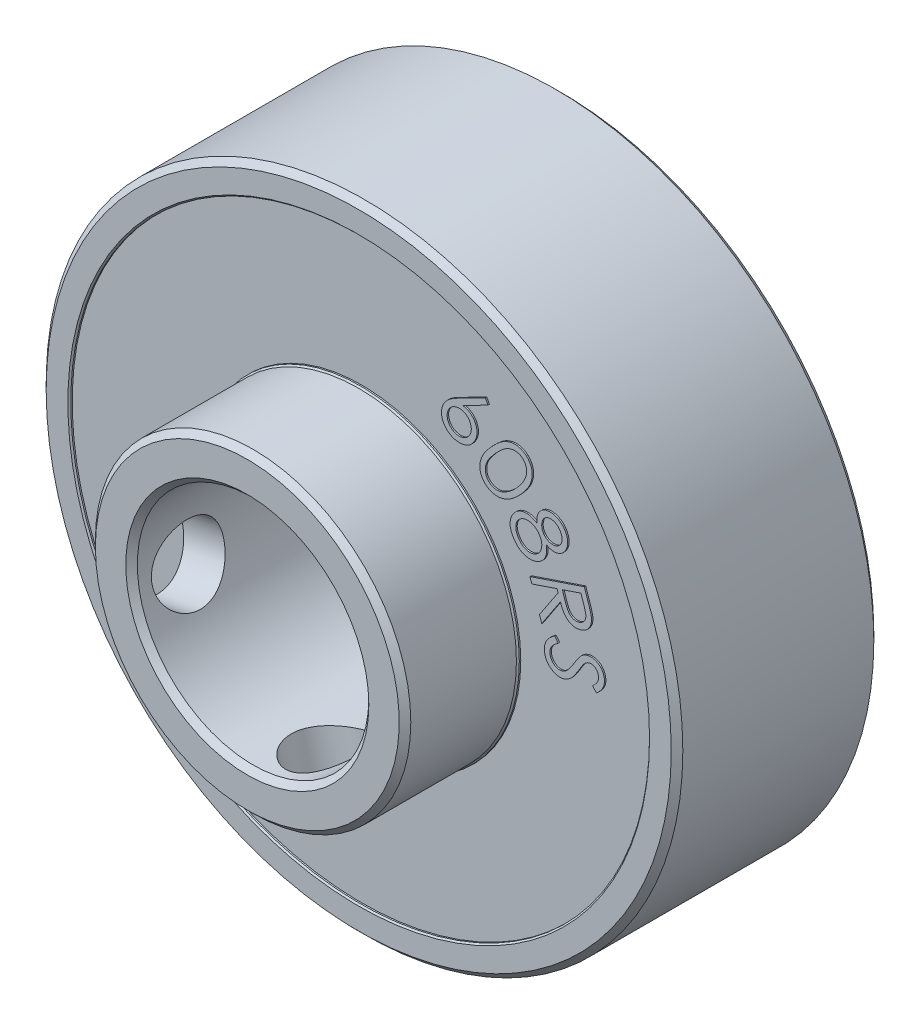
from build123d import *

# Parameters (mm, degrees)
SKETCH1_R                           = 11
SKETCH1_R_2                         = 4
BOSS_EXTRUDE1_DEPTH                 = 7
SKETCH2_R                           = 10
SKETCH2_R_2                         = 5.5
CUT_EXTRUDE1_DEPTH                  = 0.1
CUT_EXTRUDE2_START                  = -6.9
SKETCH2_2_R                         = 10
SKETCH2_2_R_2                       = 5.5
CUT_EXTRUDE2_DEPTH                  = 0.1
CHAMFER2_SIZE                       = 0.05
ESBO_O2_R                           = 5.45
ESBO_O2_R_2                         = 4
RESSALTO_EXTRUS_O1_DEPTH            = 3.85
BOSS_EXTRUDE2_DEPTH                 = 0.05
CHAMFER1_SIZE                       = 0.2
BOSS_EXTRUDE3_DEPTH                 = 0.05
FURO_ROSCADO_DE_M31_D               = 2.5
FURO_ROSCADO_DE_M31_DEPTH           = 7.5
FURO_ROSCADO_DE_M31_TIP             = 0.751075774
FURO_ROSCADO_DE_M31_ON_FACE_2_D     = 2.5
FURO_ROSCADO_DE_M31_ON_FACE_2_DEPTH = 7.5
FURO_ROSCADO_DE_M31_ON_FACE_2_TIP   = 0.751075774
SCALE1_SCALE                        = 1.25


with BuildPart() as part:
    # Sketch1 → Boss-Extrude1 (new body)
    with BuildSketch(Plane.XY):
        Circle(SKETCH1_R)
        Circle(SKETCH1_R_2, mode=Mode.SUBTRACT)
    extrude(amount=BOSS_EXTRUDE1_DEPTH)

    # Sketch2 → Cut-Extrude1 (cut)
    with BuildSketch(Plane.XY.offset(7)):
        Circle(SKETCH2_R)
        Circle(SKETCH2_R_2, mode=Mode.SUBTRACT)
    extrude(amount=-CUT_EXTRUDE1_DEPTH, mode=Mode.SUBTRACT)

    # Sketch2<2> → Cut-Extrude2 (cut)
    with BuildSketch(Plane.XY.offset(7).offset(CUT_EXTRUDE2_START)):
        Circle(SKETCH2_2_R)
        Circle(SKETCH2_2_R_2, mode=Mode.SUBTRACT)
    extrude(amount=-CUT_EXTRUDE2_DEPTH, mode=Mode.SUBTRACT)

    # Chamfer2
    chamfer2_edges = [part.edges().sort_by_distance(p)[0] for p in [
        (-5.5, 0, 7),
        (-10, 0, 7),
        (-10, 0, 0),
        (-5.5, 0, 0),
    ]]
    chamfer(chamfer2_edges, length=CHAMFER2_SIZE)

    # Esboço2 → Ressalto-extrusão1 (add)
    with BuildSketch(Plane.XY.offset(7)):
        Circle(ESBO_O2_R)
        Circle(ESBO_O2_R_2, mode=Mode.SUBTRACT)
    extrude(amount=RESSALTO_EXTRUS_O1_DEPTH)

    # Sketch3 → Boss-Extrude2 (add)
    # profile 1 of 5: a face of its own
    with BuildSketch(Plane(origin=(0, 0, 0.1), x_dir=(-1, 0, 0), z_dir=(0, 0, -1))):
        with BuildLine():
            Line((6.723953336, 1.374086402), (6.841741797, 1.216634479))
            add(Edge.make_bspline(
                [(6.841741797, 1.216634479), (6.817573288, 1.199359859), (6.771292818, 1.166280551), (6.7089583, 1.113159264), (6.65797847, 1.058354359), (6.616042027, 1.003718422), (6.585197602, 0.947642508), (6.564677897, 0.890789262), (6.554264641, 0.832905218), (6.556279326, 0.794387119), (6.557286669, 0.775128069)],
                knots=[0, 0, 0, 0, 1.292055059, 2.474166467, 3.555169481, 4.54276915, 5.463097752, 6.326728609, 7.163364304, 8, 8, 8, 8], degree=3))
            add(Edge.make_bspline(
                [(6.557286669, 0.775128069), (6.559589482, 0.75889953), (6.564156821, 0.726712276), (6.577499183, 0.679747808), (6.597073867, 0.635157474), (6.621192779, 0.592867963), (6.650084971, 0.554531373), (6.683420565, 0.521824686), (6.71962411, 0.494193194), (6.759139635, 0.472574946), (6.800541147, 0.456589651), (6.843001787, 0.446611622), (6.8860034, 0.441689172), (6.914655203, 0.443624683), (6.929081541, 0.444599223)],
                knots=[0, 0, 0, 0, 1.065647424, 2.113576877, 3.164384275, 4.227051853, 5.274981306, 6.276492859, 7.256630379, 8.228879028, 9.197081163, 10.13494145, 11.060932943, 12, 12, 12, 12], degree=3))
            add(Edge.make_bspline(
                [(6.929081541, 0.444599223), (6.945519436, 0.447087772), (6.978756008, 0.45211949), (7.026704444, 0.470689174), (7.073741901, 0.496394668), (7.101970562, 0.519552155), (7.116581541, 0.531538325)],
                knots=[0, 0, 0, 0, 0.947990027, 1.916786729, 2.921741833, 4, 4, 4, 4], degree=3))
            add(Edge.make_bspline(
                [(7.116581541, 0.531538325), (7.127135431, 0.541011836), (7.149222449, 0.560837855), (7.181222658, 0.595056366), (7.214764351, 0.633812728), (7.249572833, 0.677474782), (7.285307224, 0.726179014), (7.3219168, 0.780016687), (7.360652209, 0.838318589), (7.38569458, 0.879600754), (7.398632823, 0.900929351)],
                knots=[0, 0, 0, 0, 0.729441018, 1.526562937, 2.408317325, 3.366672661, 4.398852945, 5.515801495, 6.716528806, 8, 8, 8, 8], degree=3))
            add(Edge.make_bspline(
                [(7.398632823, 0.900929351), (7.411481182, 0.922096096), (7.436017587, 0.962518055), (7.472820572, 1.019379999), (7.50609449, 1.07074534), (7.537338687, 1.115557702), (7.565826722, 1.154147196), (7.591394823, 1.186795914), (7.614407064, 1.213420818), (7.629713327, 1.228338761), (7.636613592, 1.235063966)],
                knots=[0, 0, 0, 0, 1.445236574, 2.759956344, 3.953419532, 5.017350228, 5.948124348, 6.752849745, 7.43776821, 8, 8, 8, 8], degree=3))
            add(Edge.make_bspline(
                [(7.636613592, 1.235063966), (7.647453442, 1.244543907), (7.668850152, 1.263256302), (7.702463752, 1.288692966), (7.737555465, 1.310371795), (7.773613033, 1.328839241), (7.810780176, 1.344090457), (7.848714771, 1.356654507), (7.887907457, 1.365581106), (7.91448874, 1.368839266), (7.927879618, 1.370480633)],
                knots=[0, 0, 0, 0, 1.056756624, 2.085925105, 3.08957304, 4.080262677, 5.055903979, 6.035378084, 7.010280581, 8, 8, 8, 8], degree=3))
            add(Edge.make_bspline(
                [(7.927879618, 1.370480633), (7.948981269, 1.371870248), (7.990587385, 1.37461015), (8.052279005, 1.368496586), (8.111981804, 1.355515205), (8.168798048, 1.333504491), (8.222511066, 1.304967414), (8.271642008, 1.26880591), (8.315398275, 1.225611054), (8.35382237, 1.176261797), (8.385992991, 1.122092785), (8.41166226, 1.064244335), (8.429536588, 1.002885194), (8.435353033, 0.960458902), (8.438296284, 0.938990248)],
                knots=[0, 0, 0, 0, 1.01991207, 2.010960161, 2.982781706, 3.962746851, 4.943984954, 5.912890685, 6.898148972, 7.904611514, 8.925685622, 9.933656005, 10.954383679, 12, 12, 12, 12], degree=3))
            add(Edge.make_bspline(
                [(8.438296284, 0.938990248), (8.439905173, 0.916018968), (8.443100643, 0.870394895), (8.435954309, 0.802226976), (8.421251944, 0.735375989), (8.401131857, 0.681031699), (8.37977872, 0.638088379), (8.360564, 0.604548729), (8.337040201, 0.570775496), (8.310670734, 0.53558058), (8.279863744, 0.500254418), (8.246489716, 0.463106616), (8.208609747, 0.426121993), (8.181946924, 0.401530075), (8.168264233, 0.38891012)],
                knots=[0, 0, 0, 0, 1.294867467, 2.571782184, 3.843746611, 5.143215914, 5.822746795, 6.543964101, 7.318006915, 8.13942962, 9.019769218, 9.956863672, 10.951513765, 12, 12, 12, 12], degree=3))
            Line((8.168264233, 0.38891012), (8.029642438, 0.537547941))
            add(Edge.make_bspline(
                [(8.029642438, 0.537547941), (8.040491364, 0.547797716), (8.061430909, 0.567580842), (8.091198861, 0.596726402), (8.1177117, 0.624750316), (8.140998798, 0.651703899), (8.161430413, 0.677149832), (8.178807729, 0.701361339), (8.193307277, 0.724006553), (8.208313949, 0.752376209), (8.222111687, 0.78797107), (8.232490263, 0.831773931), (8.237254627, 0.876823898), (8.235338696, 0.906937777), (8.234370002, 0.922163325)],
                knots=[0, 0, 0, 0, 1.182699611, 2.282732375, 3.300866298, 4.238668036, 5.104698929, 5.88587987, 6.599324344, 7.233663973, 8.426546453, 9.612413994, 10.792838817, 12, 12, 12, 12], degree=3))
            add(Edge.make_bspline(
                [(8.234370002, 0.922163325), (8.231544844, 0.941132772), (8.226095153, 0.97772457), (8.207511221, 1.029103552), (8.179226125, 1.07342249), (8.143481188, 1.110786437), (8.101919482, 1.139998909), (8.056290048, 1.160326247), (8.006902954, 1.169811767), (7.973443836, 1.168186943), (7.956325131, 1.167355633)],
                knots=[0, 0, 0, 0, 1.109513479, 2.140235993, 3.138523126, 4.134648421, 5.117916045, 6.063936821, 7.00945106, 8, 8, 8, 8], degree=3))
            add(Edge.make_bspline(
                [(7.956325131, 1.167355633), (7.945745182, 1.165793238), (7.92452439, 1.162659454), (7.893216116, 1.154810012), (7.863019919, 1.142853978), (7.833191485, 1.128051735), (7.803915641, 1.108026169), (7.773495168, 1.083650001), (7.743435661, 1.052289809), (7.723571823, 1.029230065), (7.713136028, 1.017115248)],
                knots=[0, 0, 0, 0, 0.872627401, 1.750277355, 2.626708255, 3.518723759, 4.461878059, 5.515567722, 6.694762481, 8, 8, 8, 8], degree=3))
            add(Edge.make_bspline(
                [(7.713136028, 1.017115248), (7.709759885, 1.012601252), (7.701657657, 1.00176835), (7.688608104, 0.982001066), (7.672276268, 0.956433232), (7.65262288, 0.924978085), (7.629276842, 0.887948617), (7.60342511, 0.84439932), (7.573757222, 0.795347482), (7.552995234, 0.760582288), (7.54206231, 0.742275505)],
                knots=[0, 0, 0, 0, 0.417704147, 1.002426291, 1.754721007, 2.666443671, 3.751275867, 4.998903859, 6.419671761, 8, 8, 8, 8], degree=3))
            add(Edge.make_bspline(
                [(7.54206231, 0.742275505), (7.528720878, 0.72014766), (7.502869753, 0.677271475), (7.462909444, 0.616494005), (7.424908705, 0.560118495), (7.386533341, 0.509633022), (7.349495907, 0.463846731), (7.313037636, 0.423278472), (7.277439614, 0.387815365), (7.231706317, 0.348414155), (7.174122265, 0.307697522), (7.102778014, 0.269865497), (7.029575045, 0.243643782), (6.979473401, 0.23602383), (6.954722566, 0.232259479)],
                knots=[0, 0, 0, 0, 1.151589416, 2.231385892, 3.241866087, 4.181198595, 5.056967968, 5.86622306, 6.611257172, 7.295010099, 8.555133183, 9.745337415, 10.8861687, 12, 12, 12, 12], degree=3))
            add(Edge.make_bspline(
                [(6.954722566, 0.232259479), (6.937104145, 0.230954156), (6.902273291, 0.228373588), (6.850287945, 0.230996996), (6.799553841, 0.238604602), (6.7498888, 0.251362609), (6.70178582, 0.270191913), (6.654518449, 0.293243368), (6.609132064, 0.322693373), (6.565113537, 0.35621304), (6.524107945, 0.393956855), (6.487534332, 0.434933646), (6.45562657, 0.478557564), (6.428202178, 0.524760922), (6.405676349, 0.573922386), (6.388114701, 0.625763552), (6.37509852, 0.680239147), (6.370249322, 0.717645223), (6.367783464, 0.73666653)],
                knots=[0, 0, 0, 0, 0.985637329, 1.948562123, 2.898699275, 3.846375535, 4.804641011, 5.778360361, 6.777444169, 7.819911255, 8.864722404, 9.88397061, 10.881717925, 11.877903731, 12.878850076, 13.895148367, 14.929665032, 16, 16, 16, 16], degree=3))
            add(Edge.make_bspline(
                [(6.367783464, 0.73666653), (6.366427586, 0.751479961), (6.36374365, 0.780802889), (6.364781078, 0.824712107), (6.366958187, 0.867892434), (6.373888092, 0.910243045), (6.38267062, 0.952061727), (6.395985544, 0.99277455), (6.410879198, 1.033227048), (6.430041569, 1.072638466), (6.452506534, 1.111705681), (6.479103013, 1.150236727), (6.509821859, 1.188344837), (6.544257517, 1.226550474), (6.583270723, 1.264064543), (6.626226549, 1.301327262), (6.673295047, 1.338362343), (6.706747289, 1.361952754), (6.723953336, 1.374086402)],
                knots=[0, 0, 0, 0, 0.924783812, 1.830593555, 2.729938474, 3.612542721, 4.497647048, 5.385983185, 6.274940971, 7.178116819, 8.108855036, 9.07694148, 10.087910257, 11.152769032, 12.275211649, 13.45327497, 14.690100631, 16, 16, 16, 16], degree=3))
        make_face()
    # profile 2 of 5: a face of its own
    with BuildSketch(Plane(origin=(0, 0, 0.1), x_dir=(-1, 0, 0), z_dir=(0, 0, -1))):
        with BuildLine():
            Line((7.746137114, 3.357649879), (7.872739678, 2.983451161))
            add(Edge.make_bspline(
                [(7.872739678, 2.983451161), (7.881059185, 2.958357449), (7.896967784, 2.910373143), (7.919192418, 2.841249827), (7.93827157, 2.778162874), (7.954988951, 2.721116942), (7.968277975, 2.670083531), (7.97810167, 2.624967975), (7.986304921, 2.586220173), (7.989206196, 2.562134117), (7.99052814, 2.551159494)],
                knots=[0, 0, 0, 0, 1.41401025, 2.703876705, 3.883389485, 4.939117467, 5.883308228, 6.703003456, 7.409033675, 8, 8, 8, 8], degree=3))
            add(Edge.make_bspline(
                [(7.99052814, 2.551159494), (7.991680371, 2.536346044), (7.993961878, 2.507014281), (7.99355178, 2.463189389), (7.989536296, 2.420458725), (7.982244147, 2.378807362), (7.971867446, 2.338150413), (7.957859366, 2.298427821), (7.940049121, 2.259949253), (7.919392559, 2.222682043), (7.895267023, 2.187520322), (7.868522083, 2.15435442), (7.838146422, 2.124526727), (7.805654899, 2.096319063), (7.769505392, 2.071821996), (7.730676725, 2.049581161), (7.689074117, 2.029824145), (7.65969703, 2.019263938), (7.644774935, 2.013899879)],
                knots=[0, 0, 0, 0, 1.027353843, 2.034239082, 3.026914782, 3.992754084, 4.956116645, 5.926055136, 6.901519887, 7.885736109, 8.869562139, 9.847691085, 10.827432488, 11.810304063, 12.819812835, 13.841795782, 14.903739854, 16, 16, 16, 16], degree=3))
            add(Edge.make_bspline(
                [(7.644774935, 2.013899879), (7.619571721, 2.006225956), (7.570483848, 1.991279587), (7.495245456, 1.981482942), (7.421726968, 1.981550073), (7.350113043, 1.99285135), (7.28164526, 2.01459628), (7.217050526, 2.046407449), (7.157909987, 2.089546729), (7.111856988, 2.132170274), (7.078246075, 2.172604827), (7.052872874, 2.206693439), (7.028502864, 2.24470871), (7.00542963, 2.286885007), (6.981948203, 2.332291093), (6.960215509, 2.382102891), (6.938952909, 2.435460163), (6.925647847, 2.472458787), (6.918813396, 2.491463981)],
                knots=[0, 0, 0, 0, 1.278263464, 2.489652168, 3.670679834, 4.839936614, 5.997393751, 7.149490657, 8.321732671, 9.542815408, 10.187555536, 10.874109659, 11.606713321, 12.379429923, 13.209421677, 14.089665205, 15.018712606, 16, 16, 16, 16], degree=3))
            Line((6.918813396, 2.491463981), (6.274181986, 1.519909494))
            Line((6.274181986, 1.519909494), (6.195656345, 1.75268193))
            Line((6.195656345, 1.75268193), (6.840688396, 2.722633853))
            Line((6.840688396, 2.722633853), (6.804630704, 2.829605007))
            Line((6.804630704, 2.829605007), (5.931233268, 2.53393193))
            Line((5.931233268, 2.53393193), (5.867531345, 2.721832571))
            Line((5.867531345, 2.721832571), (7.746137114, 3.357649879))
        make_face()
        with BuildLine():
            Line((7.625944806, 3.107649879), (6.987323011, 2.891303725))
            Line((6.987323011, 2.891303725), (7.093893524, 2.567585776))
            add(Edge.make_bspline(
                [(7.093893524, 2.567585776), (7.099141602, 2.552460366), (7.109268083, 2.523274973), (7.12546665, 2.481526975), (7.141165795, 2.442969417), (7.157905934, 2.408224542), (7.173577508, 2.37635315), (7.19005439, 2.34833638), (7.206517147, 2.323717963), (7.228098548, 2.295648952), (7.257158343, 2.265709238), (7.296463649, 2.236869944), (7.338965987, 2.214103265), (7.38510297, 2.199047445), (7.432884658, 2.190547052), (7.481570808, 2.189590563), (7.530612026, 2.194710922), (7.562229046, 2.204464605), (7.578268524, 2.209412699)],
                knots=[0, 0, 0, 0, 1.118554581, 2.158318542, 3.128777667, 4.026236993, 4.852521549, 5.609511046, 6.2953485, 6.920617761, 8.081985124, 9.196171859, 10.314843201, 11.436157874, 12.572935431, 13.69304583, 14.829670183, 16, 16, 16, 16], degree=3))
            add(Edge.make_bspline(
                [(7.578268524, 2.209412699), (7.59342902, 2.215251964), (7.62342383, 2.226804859), (7.664579795, 2.251684726), (7.701464878, 2.282014563), (7.733367565, 2.317620085), (7.759719917, 2.357194019), (7.780045409, 2.399320856), (7.793065142, 2.44385535), (7.798012121, 2.482767203), (7.798617957, 2.516069958), (7.796430694, 2.544330853), (7.791830588, 2.575579595), (7.785411015, 2.609926292), (7.776957572, 2.647370858), (7.766058218, 2.687842945), (7.752740917, 2.731460489), (7.742856393, 2.761514748), (7.737723652, 2.777121033)],
                knots=[0, 0, 0, 0, 1.157480747, 2.290057996, 3.413820966, 4.554229024, 5.688088466, 6.796349954, 7.878911532, 8.984095935, 9.584534887, 10.253304793, 11.003966908, 11.837573395, 12.74613744, 13.742422656, 14.827707137, 16, 16, 16, 16], degree=3))
            Line((7.737723652, 2.777121033), (7.625944806, 3.107649879))
        make_face(mode=Mode.SUBTRACT)
    # profile 3 of 5: a face of its own
    with BuildSketch(Plane(origin=(0, 0, 0.1), x_dir=(-1, 0, 0), z_dir=(0, 0, -1))):
        with BuildLine():
            add(Edge.make_bspline(
                [(6.436645373, 3.958851709), (6.438849744, 3.940573746), (6.443153326, 3.904889774), (6.446080097, 3.852458084), (6.447345332, 3.802571834), (6.444615596, 3.755237655), (6.440242818, 3.710182835), (6.431945321, 3.667690701), (6.421801836, 3.627540907), (6.408467872, 3.589869698), (6.392118978, 3.554645749), (6.374421381, 3.520656156), (6.353059749, 3.489126668), (6.330588283, 3.458332588), (6.304473045, 3.429986163), (6.276658623, 3.402650225), (6.246016539, 3.377299569), (6.224148017, 3.36201487), (6.213087681, 3.354284402)],
                knots=[0, 0, 0, 0, 1.290890309, 2.520198396, 3.681805585, 4.788490099, 5.843551436, 6.853927339, 7.821726867, 8.74603337, 9.651448064, 10.544029729, 11.429902383, 12.319727641, 13.215057227, 14.129151139, 15.053789794, 16, 16, 16, 16], degree=3))
            add(Edge.make_bspline(
                [(6.213087681, 3.354284402), (6.197080539, 3.344144505), (6.165376402, 3.324061175), (6.115609733, 3.298721518), (6.064443052, 3.278646051), (6.012154311, 3.263322512), (5.958510855, 3.252871046), (5.903673026, 3.247212262), (5.847609117, 3.246868388), (5.810160039, 3.250090216), (5.791212681, 3.251720299)],
                knots=[0, 0, 0, 0, 1.02459754, 2.029343036, 3.015319328, 3.993724459, 4.972689464, 5.967517749, 6.971665777, 8, 8, 8, 8], degree=3))
            add(Edge.make_bspline(
                [(5.791212681, 3.251720299), (5.76812279, 3.255152686), (5.722105673, 3.26199328), (5.655371216, 3.282467937), (5.591465368, 3.310695655), (5.530691013, 3.347287029), (5.472409223, 3.391028314), (5.417139616, 3.44291569), (5.364964002, 3.502778785), (5.333693598, 3.547097948), (5.317654988, 3.569829274)],
                knots=[0, 0, 0, 0, 0.94927729, 1.891867025, 2.831441269, 3.787189233, 4.773456595, 5.792841766, 6.867947176, 8, 8, 8, 8], degree=3))
            add(Edge.make_bspline(
                [(5.317654988, 3.569829274), (5.303063571, 3.592276258), (5.274661246, 3.635969511), (5.240442419, 3.70396576), (5.213126694, 3.770723532), (5.193673612, 3.836759996), (5.18189304, 3.902041339), (5.177652501, 3.9664582), (5.181746591, 4.030123994), (5.193666901, 4.092147537), (5.210811163, 4.152011519), (5.232533781, 4.208453206), (5.257704373, 4.261497857), (5.287473484, 4.310315858), (5.320899663, 4.355598373), (5.358263051, 4.396995678), (5.399718813, 4.434649249), (5.43013903, 4.456340746), (5.445459476, 4.467265171)],
                knots=[0, 0, 0, 0, 1.265189782, 2.462703114, 3.593198436, 4.67234407, 5.711673085, 6.724080211, 7.71757927, 8.719632106, 9.70506986, 10.658584755, 11.576575664, 12.477685061, 13.358041525, 14.234425087, 15.110808649, 16, 16, 16, 16], degree=3))
            add(Edge.make_bspline(
                [(5.445459476, 4.467265171), (5.456987966, 4.474624406), (5.480000329, 4.489314395), (5.515649837, 4.508441139), (5.552366299, 4.524126629), (5.589327481, 4.537519912), (5.627481553, 4.547343512), (5.665928122, 4.555312832), (5.705401353, 4.558925918), (5.745399858, 4.560814177), (5.786673455, 4.559096182), (5.829078302, 4.554049573), (5.872697014, 4.544281293), (5.91778122, 4.532182679), (5.964098431, 4.515785424), (6.011833619, 4.496274612), (6.060588671, 4.472457347), (6.093098017, 4.454707355), (6.109722296, 4.445630556)],
                knots=[0, 0, 0, 0, 0.931334836, 1.859065266, 2.751202648, 3.648748233, 4.533436264, 5.43245535, 6.319384756, 7.229651734, 8.158095254, 9.129430785, 10.133761898, 11.19951572, 12.306952597, 13.477470392, 14.710056011, 16, 16, 16, 16], degree=3))
            add(Edge.make_bspline(
                [(6.109722296, 4.445630556), (6.107482301, 4.47205299), (6.10313889, 4.52328682), (6.107287375, 4.598282233), (6.11985051, 4.668288878), (6.14164351, 4.732865757), (6.171434346, 4.791786736), (6.208476731, 4.844446438), (6.252045054, 4.891203726), (6.28610488, 4.91622277), (6.303231911, 4.928803633)],
                knots=[0, 0, 0, 0, 1.159116483, 2.247558892, 3.275615725, 4.262372356, 5.218835671, 6.154236364, 7.07185513, 8, 8, 8, 8], degree=3))
            add(Edge.make_bspline(
                [(6.303231911, 4.928803633), (6.321754889, 4.940084937), (6.359014229, 4.962777505), (6.421256217, 4.986222737), (6.488036273, 5.000993457), (6.558445944, 5.007117844), (6.630670913, 5.005090507), (6.702669609, 4.992413163), (6.77329377, 4.969774079), (6.841463499, 4.937151075), (6.906181416, 4.896456921), (6.965941656, 4.848096386), (7.019799943, 4.792057066), (7.050247347, 4.749841495), (7.065651783, 4.72848312)],
                knots=[0, 0, 0, 0, 0.892779067, 1.795842916, 2.727080536, 3.70581188, 4.703144711, 5.698163754, 6.710047702, 7.752069251, 8.806330382, 9.855631886, 10.91508709, 12, 12, 12, 12], degree=3))
            add(Edge.make_bspline(
                [(7.065651783, 4.72848312), (7.079336383, 4.706774175), (7.106401224, 4.663839111), (7.136261198, 4.594226894), (7.157475004, 4.522286133), (7.168858659, 4.44845505), (7.171401759, 4.374581199), (7.164611604, 4.302250625), (7.148558493, 4.232231558), (7.122885922, 4.165630452), (7.089294662, 4.103906053), (7.0495902, 4.047721731), (7.002341174, 3.999113654), (6.966283703, 3.972535032), (6.948263963, 3.95925235)],
                knots=[0, 0, 0, 0, 1.068771019, 2.113771646, 3.146516798, 4.18939315, 5.220229497, 6.221594843, 7.210477599, 8.206485729, 9.188317762, 10.134173663, 11.067552274, 12, 12, 12, 12], degree=3))
            add(Edge.make_bspline(
                [(6.948263963, 3.95925235), (6.92948131, 3.947579211), (6.892704816, 3.924723167), (6.832726752, 3.900840341), (6.770949722, 3.886814804), (6.707208907, 3.88185386), (6.641795956, 3.887028294), (6.57452711, 3.90142974), (6.505301459, 3.925243395), (6.460060234, 3.947389739), (6.436645373, 3.958851709)],
                knots=[0, 0, 0, 0, 0.981875121, 1.922514633, 2.854567088, 3.789622669, 4.754286786, 5.76174218, 6.841576559, 8, 8, 8, 8], degree=3))
        make_face()
        with BuildLine():
            add(Edge.make_bspline(
                [(6.899786399, 4.627521581), (6.89206632, 4.638457323), (6.87685916, 4.659998761), (6.851731015, 4.689696603), (6.824543522, 4.715861262), (6.79632334, 4.739189166), (6.766173857, 4.759065259), (6.734647119, 4.775820377), (6.701543011, 4.789622008), (6.667263629, 4.799834203), (6.632827413, 4.807110393), (6.598864764, 4.810677554), (6.565845271, 4.811257308), (6.533573133, 4.808043896), (6.502305027, 4.801150813), (6.471895114, 4.791090338), (6.442508709, 4.777396374), (6.423983999, 4.765933971), (6.414610117, 4.760133761)],
                knots=[0, 0, 0, 0, 1.147797877, 2.260954539, 3.330167184, 4.38025149, 5.396817843, 6.421610434, 7.438370352, 8.467442645, 9.485040915, 10.452679454, 11.391973248, 12.312859485, 13.227240642, 14.132754951, 15.055135845, 16, 16, 16, 16], degree=3))
            add(Edge.make_bspline(
                [(6.414610117, 4.760133761), (6.405774199, 4.753786345), (6.388108367, 4.741095827), (6.364373565, 4.718498267), (6.343734102, 4.693036444), (6.324762197, 4.66560438), (6.309508042, 4.635122756), (6.296405059, 4.602338894), (6.286620035, 4.566820361), (6.27902636, 4.529487679), (6.274755334, 4.491152689), (6.273205383, 4.453199531), (6.276275975, 4.416049243), (6.282273469, 4.379861769), (6.29134367, 4.344469632), (6.304515391, 4.310097751), (6.320673305, 4.276359421), (6.334378057, 4.255189882), (6.341292809, 4.244508761)],
                knots=[0, 0, 0, 0, 0.908844192, 1.81707094, 2.729132775, 3.645761934, 4.599514883, 5.571907187, 6.593318126, 7.675011067, 8.753876802, 9.815092739, 10.84525358, 11.863975947, 12.879511735, 13.893573417, 14.937199413, 16, 16, 16, 16], degree=3))
            add(Edge.make_bspline(
                [(6.341292809, 4.244508761), (6.350814274, 4.231255034), (6.369827412, 4.204789049), (6.404691636, 4.170598056), (6.443344082, 4.140394154), (6.485652106, 4.115036742), (6.53091205, 4.095367527), (6.577788532, 4.082025189), (6.625777609, 4.074990316), (6.673984131, 4.075405122), (6.721007008, 4.080627131), (6.765184168, 4.092077638), (6.806448491, 4.107815252), (6.831074035, 4.122859441), (6.843296014, 4.130326068)],
                knots=[0, 0, 0, 0, 1.029778083, 2.056334151, 3.072742447, 4.125103068, 5.164692881, 6.18264204, 7.197261409, 8.21856438, 9.221531217, 10.179595353, 11.096509409, 12, 12, 12, 12], degree=3))
            add(Edge.make_bspline(
                [(6.843296014, 4.130326068), (6.851446438, 4.13616324), (6.867594435, 4.147728114), (6.88939698, 4.168131937), (6.90904658, 4.190508833), (6.92640353, 4.215277105), (6.941639015, 4.242075679), (6.954455745, 4.271261696), (6.965288178, 4.302452796), (6.973600755, 4.335686204), (6.979511889, 4.370209731), (6.980683648, 4.405777115), (6.977172407, 4.441591107), (6.970465098, 4.478043747), (6.9591051, 4.514969221), (6.943248573, 4.552252268), (6.923519635, 4.590151684), (6.907856867, 4.614813977), (6.899786399, 4.627521581)],
                knots=[0, 0, 0, 0, 0.860567069, 1.704995385, 2.558804371, 3.415153889, 4.298967395, 5.203031682, 6.150124742, 7.132495547, 8.143595732, 9.153914339, 10.17923786, 11.230179396, 12.333615959, 13.490750709, 14.707072956, 16, 16, 16, 16], degree=3))
        make_face(mode=Mode.SUBTRACT)
        with BuildLine():
            add(Edge.make_bspline(
                [(6.192654988, 4.141544017), (6.183073031, 4.155401294), (6.164227572, 4.182655302), (6.131187317, 4.218933327), (6.097015473, 4.252070626), (6.059989677, 4.280785033), (6.020837675, 4.305788703), (5.978908288, 4.326108106), (5.934953683, 4.342757084), (5.889255118, 4.354794419), (5.843074833, 4.363522847), (5.797427161, 4.366805064), (5.753115121, 4.366894985), (5.710232395, 4.361231726), (5.668413788, 4.352462102), (5.628232574, 4.337906769), (5.58882321, 4.320171181), (5.564407056, 4.304523989), (5.552029988, 4.296592094)],
                knots=[0, 0, 0, 0, 1.103096915, 2.169532516, 3.209705979, 4.22005898, 5.235178716, 6.249127762, 7.268541052, 8.31114268, 9.343069619, 10.344088993, 11.307028603, 12.241865975, 13.174241085, 14.101672058, 15.037697202, 16, 16, 16, 16], degree=3))
            add(Edge.make_bspline(
                [(5.552029988, 4.296592094), (5.53739373, 4.285920167), (5.508158373, 4.264603408), (5.470459325, 4.225147952), (5.438160928, 4.180583136), (5.411429753, 4.131524815), (5.391128257, 4.078821031), (5.379712135, 4.02334043), (5.375573245, 3.966204794), (5.379709706, 3.907692931), (5.391978104, 3.848519155), (5.411845955, 3.789219006), (5.439605058, 3.729865997), (5.463581076, 3.692173419), (5.475908194, 3.672794017)],
                knots=[0, 0, 0, 0, 0.926109246, 1.849867156, 2.780058085, 3.737943589, 4.703270699, 5.660960876, 6.627667837, 7.628486545, 8.654526651, 9.714225142, 10.824783286, 12, 12, 12, 12], degree=3))
            add(Edge.make_bspline(
                [(5.475908194, 3.672794017), (5.486060461, 3.658170197), (5.505883669, 3.629615884), (5.539352829, 3.591150094), (5.574498341, 3.557119283), (5.611193238, 3.52754691), (5.649610266, 3.502113814), (5.690285635, 3.482258235), (5.73254201, 3.466467844), (5.776087466, 3.455386323), (5.819965834, 3.44854851), (5.863310687, 3.446190652), (5.905570882, 3.447721693), (5.946649447, 3.453327605), (5.986515083, 3.463003588), (6.025261611, 3.476638949), (6.062787941, 3.494832298), (6.086485292, 3.509769369), (6.098504347, 3.517345299)],
                knots=[0, 0, 0, 0, 1.19035752, 2.32427924, 3.40484362, 4.459799014, 5.473418872, 6.48040078, 7.481219341, 8.486773131, 9.481309882, 10.447796045, 11.386669185, 12.306601008, 13.216804754, 14.126789189, 15.049926509, 16, 16, 16, 16], degree=3))
            add(Edge.make_bspline(
                [(6.098504347, 3.517345299), (6.109623379, 3.525413647), (6.131612455, 3.541369668), (6.161538623, 3.568937135), (6.18821179, 3.599437638), (6.210866349, 3.633334346), (6.230793072, 3.669716469), (6.247216973, 3.709047676), (6.259874558, 3.751393122), (6.269542145, 3.795841921), (6.274911413, 3.841443699), (6.276921551, 3.886781556), (6.273360853, 3.931306877), (6.266335015, 3.975088203), (6.254596548, 4.018173699), (6.238424813, 4.06039773), (6.21802423, 4.101939076), (6.201197342, 4.128208206), (6.192654988, 4.141544017)],
                knots=[0, 0, 0, 0, 0.942671861, 1.864234432, 2.78725575, 3.718123832, 4.657802721, 5.631928245, 6.638488188, 7.688830978, 8.751153965, 9.788000563, 10.799352584, 11.812407604, 12.828984143, 13.859322421, 14.913261601, 16, 16, 16, 16], degree=3))
        make_face(mode=Mode.SUBTRACT)
    # profile 4 of 5: a face of its own
    with BuildSketch(Plane(origin=(0, 0, 0.1), x_dir=(-1, 0, 0), z_dir=(0, 0, -1))):
        with BuildLine():
            add(Edge.make_bspline(
                [(4.543033426, 5.949335529), (4.564943157, 5.972693181), (4.607527355, 6.018091587), (4.67157506, 6.0821776), (4.733665606, 6.140505217), (4.794137626, 6.192741517), (4.85293655, 6.238729797), (4.909649751, 6.279135227), (4.964441144, 6.313866459), (5.018164906, 6.342452083), (5.070566701, 6.366205448), (5.122024451, 6.38603643), (5.172895525, 6.401712181), (5.223134838, 6.413290127), (5.272621026, 6.421532789), (5.321665929, 6.425568094), (5.370160168, 6.42549656), (5.417968316, 6.42189385), (5.464631842, 6.414853045), (5.509827437, 6.403785557), (5.553710443, 6.389848585), (5.596047144, 6.372253298), (5.636808987, 6.351171515), (5.676066811, 6.327121226), (5.714074787, 6.299926787), (5.737519741, 6.279144916), (5.749363554, 6.268646427)],
                knots=[0, 0, 0, 0, 1.642537938, 3.192470103, 4.646338539, 6.011168142, 7.289605298, 8.473669563, 9.581665276, 10.614373007, 11.59226402, 12.531086133, 13.441104306, 14.320069679, 15.173659948, 16.012137794, 16.84096325, 17.65841702, 18.469272155, 19.258427056, 20.042601694, 20.82874835, 21.606886513, 22.39398752, 23.188682081, 24, 24, 24, 24], degree=3))
            add(Edge.make_bspline(
                [(5.749363554, 6.268646427), (5.760911716, 6.257617316), (5.783832443, 6.2357268), (5.814606127, 6.199685182), (5.842763625, 6.162273296), (5.86720813, 6.122744115), (5.888632845, 6.081687155), (5.906688759, 6.038659944), (5.921436917, 5.993756214), (5.933125957, 5.947322605), (5.941123235, 5.899359884), (5.945576238, 5.850210478), (5.945937318, 5.799696325), (5.942178582, 5.748167993), (5.934948076, 5.695283356), (5.923723996, 5.64133292), (5.908257359, 5.586132596), (5.889035669, 5.529625786), (5.865374627, 5.471491833), (5.83582998, 5.412255968), (5.80126516, 5.351314775), (5.761491532, 5.288687708), (5.716170301, 5.224741752), (5.665349958, 5.159251463), (5.609380215, 5.092013278), (5.569231642, 5.047489171), (5.5486424, 5.024656042)],
                knots=[0, 0, 0, 0, 0.812736739, 1.613115341, 2.410193159, 3.195255584, 3.977011722, 4.766451224, 5.568648116, 6.381840011, 7.202505524, 8.042362829, 8.892510741, 9.771967907, 10.671265438, 11.608935862, 12.575845681, 13.588824347, 14.647177854, 15.769502049, 16.957239641, 18.213799721, 19.545973321, 20.947120805, 22.434403522, 24, 24, 24, 24], degree=3))
            add(Edge.make_bspline(
                [(5.5486424, 5.024656042), (5.527680493, 5.002353903), (5.486797486, 4.958856979), (5.424765374, 4.897538301), (5.363751907, 4.841756827), (5.304193874, 4.791136914), (5.245683972, 4.746127832), (5.188196251, 4.706632475), (5.131917607, 4.672564327), (5.076622511, 4.643827313), (5.022302089, 4.620150633), (4.968866404, 4.60056073), (4.916443523, 4.584153257), (4.864386266, 4.572744454), (4.813189003, 4.564345172), (4.762509713, 4.561020629), (4.712689965, 4.560768112), (4.663807528, 4.564917701), (4.616099552, 4.572413487), (4.569931105, 4.58374163), (4.525340014, 4.598193132), (4.482211508, 4.615751886), (4.440882307, 4.637302377), (4.400706003, 4.661523567), (4.362510463, 4.689746565), (4.338690087, 4.710774866), (4.326687272, 4.721370786)],
                knots=[0, 0, 0, 0, 1.559433233, 3.041436978, 4.443008781, 5.770818333, 7.022943957, 8.202580838, 9.32288808, 10.372875569, 11.375398524, 12.339881119, 13.271916542, 14.171621232, 15.053181812, 15.912749435, 16.756523382, 17.589472185, 18.409479342, 19.214872608, 20.008917662, 20.796169375, 21.584390954, 22.381462505, 23.184437513, 24, 24, 24, 24], degree=3))
            add(Edge.make_bspline(
                [(4.326687272, 4.721370786), (4.315260387, 4.732257291), (4.292582092, 4.753863126), (4.262524999, 4.789474989), (4.234216651, 4.825811541), (4.210591491, 4.864827354), (4.189388006, 4.905106752), (4.171852571, 4.947252998), (4.157409917, 4.991049596), (4.146081336, 5.036416821), (4.1385724, 5.083328133), (4.134475716, 5.131406743), (4.134526669, 5.180589449), (4.138668218, 5.230653261), (4.146378676, 5.281762522), (4.157589801, 5.333992266), (4.172890384, 5.387243797), (4.192316993, 5.44187928), (4.216511887, 5.49808747), (4.245828348, 5.556425299), (4.281385112, 5.616628969), (4.322888369, 5.67887757), (4.369244831, 5.744006213), (4.421956893, 5.810719564), (4.480129534, 5.879757147), (4.521656172, 5.925690016), (4.543033426, 5.949335529)],
                knots=[0, 0, 0, 0, 0.809667474, 1.606901415, 2.389915423, 3.171938179, 3.944739181, 4.725317868, 5.512374, 6.310580304, 7.123290289, 7.948912628, 8.785395908, 9.645186643, 10.525642855, 11.437417869, 12.385812245, 13.368196359, 14.41253519, 15.525600646, 16.717987141, 17.999697683, 19.365829755, 20.821103961, 22.363554732, 24, 24, 24, 24], degree=3))
        make_face()
        with BuildLine():
            add(Edge.make_bspline(
                [(4.679251375, 5.818325914), (4.660851677, 5.798119355), (4.625169821, 5.75893352), (4.575066406, 5.700527005), (4.530060028, 5.644381866), (4.490109119, 5.590608243), (4.454150268, 5.539934716), (4.423546398, 5.49144367), (4.398220443, 5.445165553), (4.377241144, 5.40129025), (4.35988931, 5.359114478), (4.347091963, 5.31763911), (4.335718979, 5.277328241), (4.328855361, 5.237439496), (4.323935339, 5.198395489), (4.323658489, 5.159929724), (4.324705927, 5.122099941), (4.332062828, 5.073644615), (4.346039936, 5.016229297), (4.372941953, 4.953168665), (4.40806014, 4.896592751), (4.438775126, 4.865487268), (4.454091118, 4.849976555)],
                knots=[0, 0, 0, 0, 1.475488141, 2.861359785, 4.154121984, 5.359730204, 6.477947551, 7.508249804, 8.453740252, 9.324547233, 10.133287385, 10.913161477, 11.667000762, 12.392548848, 13.096455606, 13.788819075, 14.467224618, 15.137185669, 16.431314552, 17.646052312, 18.826206712, 20, 20, 20, 20], degree=3))
            add(Edge.make_bspline(
                [(4.454091118, 4.849976555), (4.470998304, 4.835844543), (4.504676122, 4.807694658), (4.563731671, 4.776736661), (4.628146618, 4.755513764), (4.685580759, 4.74573126), (4.73346006, 4.743796713), (4.770607522, 4.744784191), (4.808256766, 4.749765726), (4.846476655, 4.7579731), (4.885356808, 4.768707571), (4.924789742, 4.782747964), (4.964461886, 4.800624278), (4.990744591, 4.814196805), (5.004171247, 4.821130401)],
                knots=[0, 0, 0, 0, 1.34190696, 2.672975875, 4.03914862, 5.469008549, 6.211498008, 6.961821166, 7.734266787, 8.525620103, 9.346360653, 10.194610762, 11.077707539, 12, 12, 12, 12], degree=3))
            add(Edge.make_bspline(
                [(5.004171247, 4.821130401), (5.020977638, 4.830421862), (5.055134219, 4.849305423), (5.105185594, 4.881764095), (5.155673749, 4.917150584), (5.205669506, 4.95682755), (5.256454512, 4.999267098), (5.306984725, 5.045647846), (5.35784608, 5.095550455), (5.390788359, 5.130831575), (5.407616759, 5.14885476)],
                knots=[0, 0, 0, 0, 0.882398032, 1.79334748, 2.740232888, 3.715191852, 4.725879822, 5.7816566, 6.866770249, 8, 8, 8, 8], degree=3))
            add(Edge.make_bspline(
                [(5.407616759, 5.14885476), (5.424180747, 5.167029522), (5.45658333, 5.202583114), (5.501733152, 5.256702416), (5.543098053, 5.309660342), (5.58077131, 5.361374876), (5.615025998, 5.411615164), (5.644765307, 5.461224488), (5.670823679, 5.509629921), (5.693361068, 5.556938809), (5.712272001, 5.603065203), (5.727612485, 5.647874505), (5.739126559, 5.691583045), (5.748400632, 5.733736142), (5.752834323, 5.774825331), (5.755220583, 5.814429798), (5.753676352, 5.852830865), (5.746508693, 5.901432573), (5.732173642, 5.958555869), (5.706135375, 6.021663456), (5.67073215, 6.07767327), (5.640308497, 6.108613984), (5.625164836, 6.124015016)],
                knots=[0, 0, 0, 0, 1.327465575, 2.596797036, 3.803974219, 4.954802096, 6.050653377, 7.085610932, 8.075932289, 9.017660852, 9.913387465, 10.766122373, 11.572387875, 12.35293663, 13.093430198, 13.800930815, 14.493692928, 15.163603914, 16.450647312, 17.662487793, 18.836481221, 20, 20, 20, 20], degree=3))
            add(Edge.make_bspline(
                [(5.625164836, 6.124015016), (5.608285103, 6.138200877), (5.574619324, 6.166493862), (5.514977812, 6.196712457), (5.450201973, 6.218295255), (5.392180613, 6.227466046), (5.343795213, 6.230492325), (5.306274605, 6.228545799), (5.268394949, 6.224194501), (5.229871713, 6.21704111), (5.190985821, 6.205984316), (5.151532352, 6.192011613), (5.111544201, 6.174986568), (5.070779705, 6.154839157), (5.028631981, 6.130550497), (4.984923072, 6.100987844), (4.939041603, 6.06649501), (4.89071745, 6.027165691), (4.840939904, 5.982142624), (4.788729648, 5.932288445), (4.734224356, 5.877502417), (4.697964293, 5.838469719), (4.679251375, 5.818325914)],
                knots=[0, 0, 0, 0, 1.186933895, 2.367280006, 3.582519422, 4.861472594, 5.525769364, 6.196917143, 6.886441279, 7.583575583, 8.309531112, 9.066613021, 9.841978912, 10.654534034, 11.520211795, 12.46606624, 13.501419929, 14.618477826, 15.828573167, 17.123883194, 18.515707565, 20, 20, 20, 20], degree=3))
        make_face(mode=Mode.SUBTRACT)
    # profile 5 of 5: a face of its own
    with BuildSketch(Plane(origin=(0, 0, 0.1), x_dir=(-1, 0, 0), z_dir=(0, 0, -1))):
        with BuildLine():
            Line((4.324964443, 7.302356675), (4.416310597, 7.130481675))
            Line((4.416310597, 7.130481675), (3.555733674, 6.680962444))
            add(Edge.make_bspline(
                [(3.555733674, 6.680962444), (3.573820412, 6.677343593), (3.609234202, 6.670257891), (3.660020503, 6.655631802), (3.706959766, 6.637037992), (3.736127944, 6.622159713), (3.750445212, 6.614856675)],
                knots=[0, 0, 0, 0, 1.071524611, 2.098042594, 3.06641979, 4, 4, 4, 4], degree=3))
            add(Edge.make_bspline(
                [(3.750445212, 6.614856675), (3.767080526, 6.605028081), (3.79973166, 6.585736909), (3.844667082, 6.551553291), (3.885064799, 6.513987171), (3.921262857, 6.472864589), (3.951945795, 6.427668961), (3.978773631, 6.379220739), (4.000582274, 6.327012973), (4.018191547, 6.272085969), (4.030461657, 6.21560422), (4.037588265, 6.158731496), (4.038082899, 6.102220894), (4.033932701, 6.045949965), (4.023286554, 5.990142073), (4.007124801, 5.934646585), (3.985547474, 5.879431036), (3.966999274, 5.843995875), (3.957576622, 5.825994495)],
                knots=[0, 0, 0, 0, 1.019907112, 2.001833211, 2.975106465, 3.930005657, 4.888753167, 5.854816606, 6.850530802, 7.872265815, 8.897525529, 9.899342728, 10.89405696, 11.877628612, 12.875140218, 13.888660536, 14.927420607, 16, 16, 16, 16], degree=3))
            add(Edge.make_bspline(
                [(3.957576622, 5.825994495), (3.943401003, 5.802045015), (3.915487215, 5.75488512), (3.862951089, 5.692675141), (3.804519394, 5.638220775), (3.739385216, 5.593013878), (3.669307026, 5.556735668), (3.594664605, 5.530879797), (3.516222355, 5.515258034), (3.435036911, 5.509786674), (3.353146288, 5.514458347), (3.272777466, 5.529881756), (3.194647085, 5.555414913), (3.145724036, 5.580276576), (3.121038161, 5.592821418)],
                knots=[0, 0, 0, 0, 1.033065496, 2.034251297, 3.014475546, 3.995102051, 4.972102283, 5.939302282, 6.921736905, 7.936931798, 8.956451458, 9.962291878, 10.971801474, 12, 12, 12, 12], degree=3))
            add(Edge.make_bspline(
                [(3.121038161, 5.592821418), (3.098026879, 5.606472481), (3.0524791, 5.633492949), (2.992288878, 5.684987892), (2.938815288, 5.742646167), (2.893091356, 5.807005676), (2.856848611, 5.877071666), (2.829822579, 5.95090171), (2.814390825, 6.028443749), (2.808805845, 6.108143214), (2.813547075, 6.188295134), (2.828636553, 6.266552303), (2.852811134, 6.342529378), (2.87690699, 6.389852952), (2.889067007, 6.41373488)],
                knots=[0, 0, 0, 0, 1.012372306, 2.003856587, 2.988821669, 3.987270143, 4.9855775, 5.970178416, 6.956819527, 7.971542281, 8.990660658, 9.990237353, 10.98576963, 12, 12, 12, 12], degree=3))
            add(Edge.make_bspline(
                [(2.889067007, 6.41373488), (2.899540358, 6.431325076), (2.920940833, 6.467267588), (2.960198132, 6.517770314), (3.004943495, 6.567060495), (3.056853524, 6.615148364), (3.117971201, 6.662922917), (3.190061184, 6.711153599), (3.273543427, 6.760845263), (3.334013557, 6.792508176), (3.365829827, 6.809167572)],
                knots=[0, 0, 0, 0, 0.780869162, 1.595570546, 2.436441551, 3.320231236, 4.29319985, 5.394687772, 6.629218754, 8, 8, 8, 8], degree=3))
            Line((3.365829827, 6.809167572), (4.324964443, 7.302356675))
        make_face()
        with BuildLine():
            add(Edge.make_bspline(
                [(3.625044571, 6.485850264), (3.61246774, 6.492363366), (3.587793416, 6.505141338), (3.549283998, 6.520055204), (3.510411292, 6.531042293), (3.47074979, 6.537397013), (3.430752873, 6.539819896), (3.390231954, 6.538126728), (3.349267971, 6.532580911), (3.30840025, 6.522524522), (3.268684526, 6.508902031), (3.230704875, 6.492745024), (3.195685684, 6.472411), (3.163091352, 6.449070139), (3.13272335, 6.422628438), (3.105710691, 6.392249296), (3.080338604, 6.359286415), (3.066163338, 6.335110707), (3.058938802, 6.322789367)],
                knots=[0, 0, 0, 0, 1.036538255, 2.033571136, 3.018249213, 3.98933273, 4.969044784, 5.947780153, 6.95464472, 7.991182975, 9.024116511, 10.027031361, 11.00835282, 11.982631912, 12.959655734, 13.949709709, 14.955053332, 16, 16, 16, 16], degree=3))
            add(Edge.make_bspline(
                [(3.058938802, 6.322789367), (3.052424832, 6.310212609), (3.039645159, 6.28553843), (3.024743633, 6.247027964), (3.013710803, 6.208159143), (3.007523505, 6.168474735), (3.004467656, 6.128522842), (3.006132907, 6.087928786), (3.012460373, 6.047110429), (3.02173914, 6.006096324), (3.035393603, 5.966315568), (3.05221016, 5.928670302), (3.071880169, 5.893304629), (3.095339468, 5.860838927), (3.121746631, 5.830604201), (3.151755643, 5.803329461), (3.184551656, 5.778180829), (3.208612752, 5.764176376), (3.220797776, 5.757084239)],
                knots=[0, 0, 0, 0, 1.037953187, 2.036347074, 3.022369291, 3.994778392, 4.976462996, 5.956534394, 6.96615164, 8.001838703, 9.036182251, 10.044421244, 11.022239489, 11.997848527, 12.976206041, 13.960378582, 14.967094555, 16, 16, 16, 16], degree=3))
            add(Edge.make_bspline(
                [(3.220797776, 5.757084239), (3.233377904, 5.750582598), (3.258058696, 5.737827114), (3.296488373, 5.722763061), (3.335498991, 5.712383777), (3.374971571, 5.706056766), (3.414930952, 5.70302077), (3.455396792, 5.704628759), (3.496203169, 5.71105302), (3.537088515, 5.720284736), (3.576879413, 5.733924196), (3.614591623, 5.750863843), (3.650196609, 5.770325323), (3.682745964, 5.793747685), (3.712577884, 5.820567455), (3.740297359, 5.850138565), (3.765381679, 5.883121331), (3.779402485, 5.907166762), (3.786502904, 5.919343854)],
                knots=[0, 0, 0, 0, 1.038237759, 2.036905372, 3.020616447, 3.993292149, 4.965474482, 5.955602401, 6.955806131, 7.991777144, 9.026404274, 10.034919693, 11.021552688, 11.997429205, 12.968722844, 13.959819387, 14.966811367, 16, 16, 16, 16], degree=3))
            add(Edge.make_bspline(
                [(3.786502904, 5.919343854), (3.793042375, 5.931909999), (3.805987221, 5.956784611), (3.820573205, 5.99569852), (3.831638485, 6.034937419), (3.838525134, 6.074539053), (3.840844134, 6.11470636), (3.839232802, 6.155095551), (3.833585246, 6.196048891), (3.823580038, 6.236788916), (3.809963735, 6.276508839), (3.793718376, 6.314578155), (3.773506953, 6.34968447), (3.750705692, 6.382621156), (3.72391794, 6.412312718), (3.694115201, 6.439628378), (3.661283282, 6.464747606), (3.637227105, 6.478756087), (3.625044571, 6.485850264)],
                knots=[0, 0, 0, 0, 1.036883605, 2.052505109, 3.037511257, 4.020182804, 4.990456222, 5.979292736, 6.976801729, 8.013685334, 9.04696302, 10.050212019, 11.040354247, 12.009295177, 12.979321976, 13.962480355, 14.968158935, 16, 16, 16, 16], degree=3))
        make_face(mode=Mode.SUBTRACT)
    extrude(amount=BOSS_EXTRUDE2_DEPTH)

    # Chamfer1
    chamfer1_edges = [part.edges().sort_by_distance(p)[0] for p in [
        (-4, 0, 0),
        (-11, 0, 7),
        (-11, 0, 0),
        (-5.45, 0, 10.85),
        (-4, 0, 10.85),
    ]]
    chamfer(chamfer1_edges, length=CHAMFER1_SIZE)

    # Sketch4 → Boss-Extrude3 (add)
    # profile 1 of 5: a face of its own
    with BuildSketch(Plane.XY.offset(6.9)):
        with BuildLine():
            Line((6.723953336, 1.374086402), (6.841741797, 1.216634479))
            add(Edge.make_bspline(
                [(6.841741797, 1.216634479), (6.817573288, 1.199359859), (6.771292818, 1.166280551), (6.7089583, 1.113159264), (6.65797847, 1.058354359), (6.616042027, 1.003718422), (6.585197602, 0.947642508), (6.564677897, 0.890789262), (6.554264641, 0.832905218), (6.556279326, 0.794387119), (6.557286669, 0.775128069)],
                knots=[0, 0, 0, 0, 1.292055059, 2.474166467, 3.555169481, 4.54276915, 5.463097752, 6.326728609, 7.163364304, 8, 8, 8, 8], degree=3))
            add(Edge.make_bspline(
                [(6.557286669, 0.775128069), (6.559589482, 0.75889953), (6.564156821, 0.726712276), (6.577499183, 0.679747808), (6.597073867, 0.635157474), (6.621192779, 0.592867963), (6.650084971, 0.554531373), (6.683420565, 0.521824686), (6.71962411, 0.494193194), (6.759139635, 0.472574946), (6.800541147, 0.456589651), (6.843001787, 0.446611622), (6.8860034, 0.441689172), (6.914655203, 0.443624683), (6.929081541, 0.444599223)],
                knots=[0, 0, 0, 0, 1.065647424, 2.113576877, 3.164384275, 4.227051853, 5.274981306, 6.276492859, 7.256630379, 8.228879028, 9.197081163, 10.13494145, 11.060932943, 12, 12, 12, 12], degree=3))
            add(Edge.make_bspline(
                [(6.929081541, 0.444599223), (6.945519436, 0.447087772), (6.978756008, 0.45211949), (7.026704444, 0.470689174), (7.073741901, 0.496394668), (7.101970562, 0.519552155), (7.116581541, 0.531538325)],
                knots=[0, 0, 0, 0, 0.947990027, 1.916786729, 2.921741833, 4, 4, 4, 4], degree=3))
            add(Edge.make_bspline(
                [(7.116581541, 0.531538325), (7.127135431, 0.541011836), (7.149222449, 0.560837855), (7.181222658, 0.595056366), (7.214764351, 0.633812728), (7.249572833, 0.677474782), (7.285307224, 0.726179014), (7.3219168, 0.780016687), (7.360652209, 0.838318589), (7.38569458, 0.879600754), (7.398632823, 0.900929351)],
                knots=[0, 0, 0, 0, 0.729441018, 1.526562937, 2.408317325, 3.366672661, 4.398852945, 5.515801495, 6.716528806, 8, 8, 8, 8], degree=3))
            add(Edge.make_bspline(
                [(7.398632823, 0.900929351), (7.411481182, 0.922096096), (7.436017587, 0.962518055), (7.472820572, 1.019379999), (7.50609449, 1.07074534), (7.537338687, 1.115557702), (7.565826722, 1.154147196), (7.591394823, 1.186795914), (7.614407064, 1.213420818), (7.629713327, 1.228338761), (7.636613592, 1.235063966)],
                knots=[0, 0, 0, 0, 1.445236574, 2.759956344, 3.953419532, 5.017350228, 5.948124348, 6.752849745, 7.43776821, 8, 8, 8, 8], degree=3))
            add(Edge.make_bspline(
                [(7.636613592, 1.235063966), (7.647453442, 1.244543907), (7.668850152, 1.263256302), (7.702463752, 1.288692966), (7.737555465, 1.310371795), (7.773613033, 1.328839241), (7.810780176, 1.344090457), (7.848714771, 1.356654507), (7.887907457, 1.365581106), (7.91448874, 1.368839266), (7.927879618, 1.370480633)],
                knots=[0, 0, 0, 0, 1.056756624, 2.085925105, 3.08957304, 4.080262677, 5.055903979, 6.035378084, 7.010280581, 8, 8, 8, 8], degree=3))
            add(Edge.make_bspline(
                [(7.927879618, 1.370480633), (7.948981269, 1.371870248), (7.990587385, 1.37461015), (8.052279005, 1.368496586), (8.111981804, 1.355515205), (8.168798048, 1.333504491), (8.222511066, 1.304967414), (8.271642008, 1.26880591), (8.315398275, 1.225611054), (8.35382237, 1.176261797), (8.385992991, 1.122092785), (8.41166226, 1.064244335), (8.429536588, 1.002885194), (8.435353033, 0.960458902), (8.438296284, 0.938990248)],
                knots=[0, 0, 0, 0, 1.01991207, 2.010960161, 2.982781706, 3.962746851, 4.943984954, 5.912890685, 6.898148972, 7.904611514, 8.925685622, 9.933656005, 10.954383679, 12, 12, 12, 12], degree=3))
            add(Edge.make_bspline(
                [(8.438296284, 0.938990248), (8.439905173, 0.916018968), (8.443100643, 0.870394895), (8.435954309, 0.802226976), (8.421251944, 0.735375989), (8.401131857, 0.681031699), (8.37977872, 0.638088379), (8.360564, 0.604548729), (8.337040201, 0.570775496), (8.310670734, 0.53558058), (8.279863744, 0.500254418), (8.246489716, 0.463106616), (8.208609747, 0.426121993), (8.181946924, 0.401530075), (8.168264233, 0.38891012)],
                knots=[0, 0, 0, 0, 1.294867467, 2.571782184, 3.843746611, 5.143215914, 5.822746795, 6.543964101, 7.318006915, 8.13942962, 9.019769218, 9.956863672, 10.951513765, 12, 12, 12, 12], degree=3))
            Line((8.168264233, 0.38891012), (8.029642438, 0.537547941))
            add(Edge.make_bspline(
                [(8.029642438, 0.537547941), (8.040491364, 0.547797716), (8.061430909, 0.567580842), (8.091198861, 0.596726402), (8.1177117, 0.624750316), (8.140998798, 0.651703899), (8.161430413, 0.677149832), (8.178807729, 0.701361339), (8.193307277, 0.724006553), (8.208313949, 0.752376209), (8.222111687, 0.78797107), (8.232490263, 0.831773931), (8.237254627, 0.876823898), (8.235338696, 0.906937777), (8.234370002, 0.922163325)],
                knots=[0, 0, 0, 0, 1.182699611, 2.282732375, 3.300866298, 4.238668036, 5.104698929, 5.88587987, 6.599324344, 7.233663973, 8.426546453, 9.612413994, 10.792838817, 12, 12, 12, 12], degree=3))
            add(Edge.make_bspline(
                [(8.234370002, 0.922163325), (8.231544844, 0.941132772), (8.226095153, 0.97772457), (8.207511221, 1.029103552), (8.179226125, 1.07342249), (8.143481188, 1.110786437), (8.101919482, 1.139998909), (8.056290048, 1.160326247), (8.006902954, 1.169811767), (7.973443836, 1.168186943), (7.956325131, 1.167355633)],
                knots=[0, 0, 0, 0, 1.109513479, 2.140235993, 3.138523126, 4.134648421, 5.117916045, 6.063936821, 7.00945106, 8, 8, 8, 8], degree=3))
            add(Edge.make_bspline(
                [(7.956325131, 1.167355633), (7.945745182, 1.165793238), (7.92452439, 1.162659454), (7.893216116, 1.154810012), (7.863019919, 1.142853978), (7.833191485, 1.128051735), (7.803915641, 1.108026169), (7.773495168, 1.083650001), (7.743435661, 1.052289809), (7.723571823, 1.029230065), (7.713136028, 1.017115248)],
                knots=[0, 0, 0, 0, 0.872627401, 1.750277355, 2.626708255, 3.518723759, 4.461878059, 5.515567722, 6.694762481, 8, 8, 8, 8], degree=3))
            add(Edge.make_bspline(
                [(7.713136028, 1.017115248), (7.709759885, 1.012601252), (7.701657657, 1.00176835), (7.688608104, 0.982001066), (7.672276268, 0.956433232), (7.65262288, 0.924978085), (7.629276842, 0.887948617), (7.60342511, 0.84439932), (7.573757222, 0.795347482), (7.552995234, 0.760582288), (7.54206231, 0.742275505)],
                knots=[0, 0, 0, 0, 0.417704147, 1.002426291, 1.754721007, 2.666443671, 3.751275867, 4.998903859, 6.419671761, 8, 8, 8, 8], degree=3))
            add(Edge.make_bspline(
                [(7.54206231, 0.742275505), (7.528720878, 0.72014766), (7.502869753, 0.677271475), (7.462909444, 0.616494005), (7.424908705, 0.560118495), (7.386533341, 0.509633022), (7.349495907, 0.463846731), (7.313037636, 0.423278472), (7.277439614, 0.387815365), (7.231706317, 0.348414155), (7.174122265, 0.307697522), (7.102778014, 0.269865497), (7.029575045, 0.243643782), (6.979473401, 0.23602383), (6.954722566, 0.232259479)],
                knots=[0, 0, 0, 0, 1.151589416, 2.231385892, 3.241866087, 4.181198595, 5.056967968, 5.86622306, 6.611257172, 7.295010099, 8.555133183, 9.745337415, 10.8861687, 12, 12, 12, 12], degree=3))
            add(Edge.make_bspline(
                [(6.954722566, 0.232259479), (6.937104145, 0.230954156), (6.902273291, 0.228373588), (6.850287945, 0.230996996), (6.799553841, 0.238604602), (6.7498888, 0.251362609), (6.70178582, 0.270191913), (6.654518449, 0.293243368), (6.609132064, 0.322693373), (6.565113537, 0.35621304), (6.524107945, 0.393956855), (6.487534332, 0.434933646), (6.45562657, 0.478557564), (6.428202178, 0.524760922), (6.405676349, 0.573922386), (6.388114701, 0.625763552), (6.37509852, 0.680239147), (6.370249322, 0.717645223), (6.367783464, 0.73666653)],
                knots=[0, 0, 0, 0, 0.985637329, 1.948562123, 2.898699275, 3.846375535, 4.804641011, 5.778360361, 6.777444169, 7.819911255, 8.864722404, 9.88397061, 10.881717925, 11.877903731, 12.878850076, 13.895148367, 14.929665032, 16, 16, 16, 16], degree=3))
            add(Edge.make_bspline(
                [(6.367783464, 0.73666653), (6.366427586, 0.751479961), (6.36374365, 0.780802889), (6.364781078, 0.824712107), (6.366958187, 0.867892434), (6.373888092, 0.910243045), (6.38267062, 0.952061727), (6.395985544, 0.99277455), (6.410879198, 1.033227048), (6.430041569, 1.072638466), (6.452506534, 1.111705681), (6.479103013, 1.150236727), (6.509821859, 1.188344837), (6.544257517, 1.226550474), (6.583270723, 1.264064543), (6.626226549, 1.301327262), (6.673295047, 1.338362343), (6.706747289, 1.361952754), (6.723953336, 1.374086402)],
                knots=[0, 0, 0, 0, 0.924783812, 1.830593555, 2.729938474, 3.612542721, 4.497647048, 5.385983185, 6.274940971, 7.178116819, 8.108855036, 9.07694148, 10.087910257, 11.152769032, 12.275211649, 13.45327497, 14.690100631, 16, 16, 16, 16], degree=3))
        make_face()
    # profile 2 of 5: a face of its own
    with BuildSketch(Plane.XY.offset(6.9)):
        with BuildLine():
            Line((7.746137114, 3.357649879), (7.872739678, 2.983451161))
            add(Edge.make_bspline(
                [(7.872739678, 2.983451161), (7.881059185, 2.958357449), (7.896967784, 2.910373143), (7.919192418, 2.841249827), (7.93827157, 2.778162874), (7.954988951, 2.721116942), (7.968277975, 2.670083531), (7.97810167, 2.624967975), (7.986304921, 2.586220173), (7.989206196, 2.562134117), (7.99052814, 2.551159494)],
                knots=[0, 0, 0, 0, 1.41401025, 2.703876705, 3.883389485, 4.939117467, 5.883308228, 6.703003456, 7.409033675, 8, 8, 8, 8], degree=3))
            add(Edge.make_bspline(
                [(7.99052814, 2.551159494), (7.991680371, 2.536346044), (7.993961878, 2.507014281), (7.99355178, 2.463189389), (7.989536296, 2.420458725), (7.982244147, 2.378807362), (7.971867446, 2.338150413), (7.957859366, 2.298427821), (7.940049121, 2.259949253), (7.919392559, 2.222682043), (7.895267023, 2.187520322), (7.868522083, 2.15435442), (7.838146422, 2.124526727), (7.805654899, 2.096319063), (7.769505392, 2.071821996), (7.730676725, 2.049581161), (7.689074117, 2.029824145), (7.65969703, 2.019263938), (7.644774935, 2.013899879)],
                knots=[0, 0, 0, 0, 1.027353843, 2.034239082, 3.026914782, 3.992754084, 4.956116645, 5.926055136, 6.901519887, 7.885736109, 8.869562139, 9.847691085, 10.827432488, 11.810304063, 12.819812835, 13.841795782, 14.903739854, 16, 16, 16, 16], degree=3))
            add(Edge.make_bspline(
                [(7.644774935, 2.013899879), (7.619571721, 2.006225956), (7.570483848, 1.991279587), (7.495245456, 1.981482942), (7.421726968, 1.981550073), (7.350113043, 1.99285135), (7.28164526, 2.01459628), (7.217050526, 2.046407449), (7.157909987, 2.089546729), (7.111856988, 2.132170274), (7.078246075, 2.172604827), (7.052872874, 2.206693439), (7.028502864, 2.24470871), (7.00542963, 2.286885007), (6.981948203, 2.332291093), (6.960215509, 2.382102891), (6.938952909, 2.435460163), (6.925647847, 2.472458787), (6.918813396, 2.491463981)],
                knots=[0, 0, 0, 0, 1.278263464, 2.489652168, 3.670679834, 4.839936614, 5.997393751, 7.149490657, 8.321732671, 9.542815408, 10.187555536, 10.874109659, 11.606713321, 12.379429923, 13.209421677, 14.089665205, 15.018712606, 16, 16, 16, 16], degree=3))
            Line((6.918813396, 2.491463981), (6.274181986, 1.519909494))
            Line((6.274181986, 1.519909494), (6.195656345, 1.75268193))
            Line((6.195656345, 1.75268193), (6.840688396, 2.722633853))
            Line((6.840688396, 2.722633853), (6.804630704, 2.829605007))
            Line((6.804630704, 2.829605007), (5.931233268, 2.53393193))
            Line((5.931233268, 2.53393193), (5.867531345, 2.721832571))
            Line((5.867531345, 2.721832571), (7.746137114, 3.357649879))
        make_face()
        with BuildLine():
            Line((7.625944806, 3.107649879), (6.987323011, 2.891303725))
            Line((6.987323011, 2.891303725), (7.093893524, 2.567585776))
            add(Edge.make_bspline(
                [(7.093893524, 2.567585776), (7.099141602, 2.552460366), (7.109268083, 2.523274973), (7.12546665, 2.481526975), (7.141165795, 2.442969417), (7.157905934, 2.408224542), (7.173577508, 2.37635315), (7.19005439, 2.34833638), (7.206517147, 2.323717963), (7.228098548, 2.295648952), (7.257158343, 2.265709238), (7.296463649, 2.236869944), (7.338965987, 2.214103265), (7.38510297, 2.199047445), (7.432884658, 2.190547052), (7.481570808, 2.189590563), (7.530612026, 2.194710922), (7.562229046, 2.204464605), (7.578268524, 2.209412699)],
                knots=[0, 0, 0, 0, 1.118554581, 2.158318542, 3.128777667, 4.026236993, 4.852521549, 5.609511046, 6.2953485, 6.920617761, 8.081985124, 9.196171859, 10.314843201, 11.436157874, 12.572935431, 13.69304583, 14.829670183, 16, 16, 16, 16], degree=3))
            add(Edge.make_bspline(
                [(7.578268524, 2.209412699), (7.59342902, 2.215251964), (7.62342383, 2.226804859), (7.664579795, 2.251684726), (7.701464878, 2.282014563), (7.733367565, 2.317620085), (7.759719917, 2.357194019), (7.780045409, 2.399320856), (7.793065142, 2.44385535), (7.798012121, 2.482767203), (7.798617957, 2.516069958), (7.796430694, 2.544330853), (7.791830588, 2.575579595), (7.785411015, 2.609926292), (7.776957572, 2.647370858), (7.766058218, 2.687842945), (7.752740917, 2.731460489), (7.742856393, 2.761514748), (7.737723652, 2.777121033)],
                knots=[0, 0, 0, 0, 1.157480747, 2.290057996, 3.413820966, 4.554229024, 5.688088466, 6.796349954, 7.878911532, 8.984095935, 9.584534887, 10.253304793, 11.003966908, 11.837573395, 12.74613744, 13.742422656, 14.827707137, 16, 16, 16, 16], degree=3))
            Line((7.737723652, 2.777121033), (7.625944806, 3.107649879))
        make_face(mode=Mode.SUBTRACT)
    # profile 3 of 5: a face of its own
    with BuildSketch(Plane.XY.offset(6.9)):
        with BuildLine():
            add(Edge.make_bspline(
                [(6.436645373, 3.958851709), (6.438849744, 3.940573746), (6.443153326, 3.904889774), (6.446080097, 3.852458084), (6.447345332, 3.802571834), (6.444615596, 3.755237655), (6.440242818, 3.710182835), (6.431945321, 3.667690701), (6.421801836, 3.627540907), (6.408467872, 3.589869698), (6.392118978, 3.554645749), (6.374421381, 3.520656156), (6.353059749, 3.489126668), (6.330588283, 3.458332588), (6.304473045, 3.429986163), (6.276658623, 3.402650225), (6.246016539, 3.377299569), (6.224148017, 3.36201487), (6.213087681, 3.354284402)],
                knots=[0, 0, 0, 0, 1.290890309, 2.520198396, 3.681805585, 4.788490099, 5.843551436, 6.853927339, 7.821726867, 8.74603337, 9.651448064, 10.544029729, 11.429902383, 12.319727641, 13.215057227, 14.129151139, 15.053789794, 16, 16, 16, 16], degree=3))
            add(Edge.make_bspline(
                [(6.213087681, 3.354284402), (6.197080539, 3.344144505), (6.165376402, 3.324061175), (6.115609733, 3.298721518), (6.064443052, 3.278646051), (6.012154311, 3.263322512), (5.958510855, 3.252871046), (5.903673026, 3.247212262), (5.847609117, 3.246868388), (5.810160039, 3.250090216), (5.791212681, 3.251720299)],
                knots=[0, 0, 0, 0, 1.02459754, 2.029343036, 3.015319328, 3.993724459, 4.972689464, 5.967517749, 6.971665777, 8, 8, 8, 8], degree=3))
            add(Edge.make_bspline(
                [(5.791212681, 3.251720299), (5.76812279, 3.255152686), (5.722105673, 3.26199328), (5.655371216, 3.282467937), (5.591465368, 3.310695655), (5.530691013, 3.347287029), (5.472409223, 3.391028314), (5.417139616, 3.44291569), (5.364964002, 3.502778785), (5.333693598, 3.547097948), (5.317654988, 3.569829274)],
                knots=[0, 0, 0, 0, 0.94927729, 1.891867025, 2.831441269, 3.787189233, 4.773456595, 5.792841766, 6.867947176, 8, 8, 8, 8], degree=3))
            add(Edge.make_bspline(
                [(5.317654988, 3.569829274), (5.303063571, 3.592276258), (5.274661246, 3.635969511), (5.240442419, 3.70396576), (5.213126694, 3.770723532), (5.193673612, 3.836759996), (5.18189304, 3.902041339), (5.177652501, 3.9664582), (5.181746591, 4.030123994), (5.193666901, 4.092147537), (5.210811163, 4.152011519), (5.232533781, 4.208453206), (5.257704373, 4.261497857), (5.287473484, 4.310315858), (5.320899663, 4.355598373), (5.358263051, 4.396995678), (5.399718813, 4.434649249), (5.43013903, 4.456340746), (5.445459476, 4.467265171)],
                knots=[0, 0, 0, 0, 1.265189782, 2.462703114, 3.593198436, 4.67234407, 5.711673085, 6.724080211, 7.71757927, 8.719632106, 9.70506986, 10.658584755, 11.576575664, 12.477685061, 13.358041525, 14.234425087, 15.110808649, 16, 16, 16, 16], degree=3))
            add(Edge.make_bspline(
                [(5.445459476, 4.467265171), (5.456987966, 4.474624406), (5.480000329, 4.489314395), (5.515649837, 4.508441139), (5.552366299, 4.524126629), (5.589327481, 4.537519912), (5.627481553, 4.547343512), (5.665928122, 4.555312832), (5.705401353, 4.558925918), (5.745399858, 4.560814177), (5.786673455, 4.559096182), (5.829078302, 4.554049573), (5.872697014, 4.544281293), (5.91778122, 4.532182679), (5.964098431, 4.515785424), (6.011833619, 4.496274612), (6.060588671, 4.472457347), (6.093098017, 4.454707355), (6.109722296, 4.445630556)],
                knots=[0, 0, 0, 0, 0.931334836, 1.859065266, 2.751202648, 3.648748233, 4.533436264, 5.43245535, 6.319384756, 7.229651734, 8.158095254, 9.129430785, 10.133761898, 11.19951572, 12.306952597, 13.477470392, 14.710056011, 16, 16, 16, 16], degree=3))
            add(Edge.make_bspline(
                [(6.109722296, 4.445630556), (6.107482301, 4.47205299), (6.10313889, 4.52328682), (6.107287375, 4.598282233), (6.11985051, 4.668288878), (6.14164351, 4.732865757), (6.171434346, 4.791786736), (6.208476731, 4.844446438), (6.252045054, 4.891203726), (6.28610488, 4.91622277), (6.303231911, 4.928803633)],
                knots=[0, 0, 0, 0, 1.159116483, 2.247558892, 3.275615725, 4.262372356, 5.218835671, 6.154236364, 7.07185513, 8, 8, 8, 8], degree=3))
            add(Edge.make_bspline(
                [(6.303231911, 4.928803633), (6.321754889, 4.940084937), (6.359014229, 4.962777505), (6.421256217, 4.986222737), (6.488036273, 5.000993457), (6.558445944, 5.007117844), (6.630670913, 5.005090507), (6.702669609, 4.992413163), (6.77329377, 4.969774079), (6.841463499, 4.937151075), (6.906181416, 4.896456921), (6.965941656, 4.848096386), (7.019799943, 4.792057066), (7.050247347, 4.749841495), (7.065651783, 4.72848312)],
                knots=[0, 0, 0, 0, 0.892779067, 1.795842916, 2.727080536, 3.70581188, 4.703144711, 5.698163754, 6.710047702, 7.752069251, 8.806330382, 9.855631886, 10.91508709, 12, 12, 12, 12], degree=3))
            add(Edge.make_bspline(
                [(7.065651783, 4.72848312), (7.079336383, 4.706774175), (7.106401224, 4.663839111), (7.136261198, 4.594226894), (7.157475004, 4.522286133), (7.168858659, 4.44845505), (7.171401759, 4.374581199), (7.164611604, 4.302250625), (7.148558493, 4.232231558), (7.122885922, 4.165630452), (7.089294662, 4.103906053), (7.0495902, 4.047721731), (7.002341174, 3.999113654), (6.966283703, 3.972535032), (6.948263963, 3.95925235)],
                knots=[0, 0, 0, 0, 1.068771019, 2.113771646, 3.146516798, 4.18939315, 5.220229497, 6.221594843, 7.210477599, 8.206485729, 9.188317762, 10.134173663, 11.067552274, 12, 12, 12, 12], degree=3))
            add(Edge.make_bspline(
                [(6.948263963, 3.95925235), (6.92948131, 3.947579211), (6.892704816, 3.924723167), (6.832726752, 3.900840341), (6.770949722, 3.886814804), (6.707208907, 3.88185386), (6.641795956, 3.887028294), (6.57452711, 3.90142974), (6.505301459, 3.925243395), (6.460060234, 3.947389739), (6.436645373, 3.958851709)],
                knots=[0, 0, 0, 0, 0.981875121, 1.922514633, 2.854567088, 3.789622669, 4.754286786, 5.76174218, 6.841576559, 8, 8, 8, 8], degree=3))
        make_face()
        with BuildLine():
            add(Edge.make_bspline(
                [(6.899786399, 4.627521581), (6.89206632, 4.638457323), (6.87685916, 4.659998761), (6.851731015, 4.689696603), (6.824543522, 4.715861262), (6.79632334, 4.739189166), (6.766173857, 4.759065259), (6.734647119, 4.775820377), (6.701543011, 4.789622008), (6.667263629, 4.799834203), (6.632827413, 4.807110393), (6.598864764, 4.810677554), (6.565845271, 4.811257308), (6.533573133, 4.808043896), (6.502305027, 4.801150813), (6.471895114, 4.791090338), (6.442508709, 4.777396374), (6.423983999, 4.765933971), (6.414610117, 4.760133761)],
                knots=[0, 0, 0, 0, 1.147797877, 2.260954539, 3.330167184, 4.38025149, 5.396817843, 6.421610434, 7.438370352, 8.467442645, 9.485040915, 10.452679454, 11.391973248, 12.312859485, 13.227240642, 14.132754951, 15.055135845, 16, 16, 16, 16], degree=3))
            add(Edge.make_bspline(
                [(6.414610117, 4.760133761), (6.405774199, 4.753786345), (6.388108367, 4.741095827), (6.364373565, 4.718498267), (6.343734102, 4.693036444), (6.324762197, 4.66560438), (6.309508042, 4.635122756), (6.296405059, 4.602338894), (6.286620035, 4.566820361), (6.27902636, 4.529487679), (6.274755334, 4.491152689), (6.273205383, 4.453199531), (6.276275975, 4.416049243), (6.282273469, 4.379861769), (6.29134367, 4.344469632), (6.304515391, 4.310097751), (6.320673305, 4.276359421), (6.334378057, 4.255189882), (6.341292809, 4.244508761)],
                knots=[0, 0, 0, 0, 0.908844192, 1.81707094, 2.729132775, 3.645761934, 4.599514883, 5.571907187, 6.593318126, 7.675011067, 8.753876802, 9.815092739, 10.84525358, 11.863975947, 12.879511735, 13.893573417, 14.937199413, 16, 16, 16, 16], degree=3))
            add(Edge.make_bspline(
                [(6.341292809, 4.244508761), (6.350814274, 4.231255034), (6.369827412, 4.204789049), (6.404691636, 4.170598056), (6.443344082, 4.140394154), (6.485652106, 4.115036742), (6.53091205, 4.095367527), (6.577788532, 4.082025189), (6.625777609, 4.074990316), (6.673984131, 4.075405122), (6.721007008, 4.080627131), (6.765184168, 4.092077638), (6.806448491, 4.107815252), (6.831074035, 4.122859441), (6.843296014, 4.130326068)],
                knots=[0, 0, 0, 0, 1.029778083, 2.056334151, 3.072742447, 4.125103068, 5.164692881, 6.18264204, 7.197261409, 8.21856438, 9.221531217, 10.179595353, 11.096509409, 12, 12, 12, 12], degree=3))
            add(Edge.make_bspline(
                [(6.843296014, 4.130326068), (6.851446438, 4.13616324), (6.867594435, 4.147728114), (6.88939698, 4.168131937), (6.90904658, 4.190508833), (6.92640353, 4.215277105), (6.941639015, 4.242075679), (6.954455745, 4.271261696), (6.965288178, 4.302452796), (6.973600755, 4.335686204), (6.979511889, 4.370209731), (6.980683648, 4.405777115), (6.977172407, 4.441591107), (6.970465098, 4.478043747), (6.9591051, 4.514969221), (6.943248573, 4.552252268), (6.923519635, 4.590151684), (6.907856867, 4.614813977), (6.899786399, 4.627521581)],
                knots=[0, 0, 0, 0, 0.860567069, 1.704995385, 2.558804371, 3.415153889, 4.298967395, 5.203031682, 6.150124742, 7.132495547, 8.143595732, 9.153914339, 10.17923786, 11.230179396, 12.333615959, 13.490750709, 14.707072956, 16, 16, 16, 16], degree=3))
        make_face(mode=Mode.SUBTRACT)
        with BuildLine():
            add(Edge.make_bspline(
                [(6.192654988, 4.141544017), (6.183073031, 4.155401294), (6.164227572, 4.182655302), (6.131187317, 4.218933327), (6.097015473, 4.252070626), (6.059989677, 4.280785033), (6.020837675, 4.305788703), (5.978908288, 4.326108106), (5.934953683, 4.342757084), (5.889255118, 4.354794419), (5.843074833, 4.363522847), (5.797427161, 4.366805064), (5.753115121, 4.366894985), (5.710232395, 4.361231726), (5.668413788, 4.352462102), (5.628232574, 4.337906769), (5.58882321, 4.320171181), (5.564407056, 4.304523989), (5.552029988, 4.296592094)],
                knots=[0, 0, 0, 0, 1.103096915, 2.169532516, 3.209705979, 4.22005898, 5.235178716, 6.249127762, 7.268541052, 8.31114268, 9.343069619, 10.344088993, 11.307028603, 12.241865975, 13.174241085, 14.101672058, 15.037697202, 16, 16, 16, 16], degree=3))
            add(Edge.make_bspline(
                [(5.552029988, 4.296592094), (5.53739373, 4.285920167), (5.508158373, 4.264603408), (5.470459325, 4.225147952), (5.438160928, 4.180583136), (5.411429753, 4.131524815), (5.391128257, 4.078821031), (5.379712135, 4.02334043), (5.375573245, 3.966204794), (5.379709706, 3.907692931), (5.391978104, 3.848519155), (5.411845955, 3.789219006), (5.439605058, 3.729865997), (5.463581076, 3.692173419), (5.475908194, 3.672794017)],
                knots=[0, 0, 0, 0, 0.926109246, 1.849867156, 2.780058085, 3.737943589, 4.703270699, 5.660960876, 6.627667837, 7.628486545, 8.654526651, 9.714225142, 10.824783286, 12, 12, 12, 12], degree=3))
            add(Edge.make_bspline(
                [(5.475908194, 3.672794017), (5.486060461, 3.658170197), (5.505883669, 3.629615884), (5.539352829, 3.591150094), (5.574498341, 3.557119283), (5.611193238, 3.52754691), (5.649610266, 3.502113814), (5.690285635, 3.482258235), (5.73254201, 3.466467844), (5.776087466, 3.455386323), (5.819965834, 3.44854851), (5.863310687, 3.446190652), (5.905570882, 3.447721693), (5.946649447, 3.453327605), (5.986515083, 3.463003588), (6.025261611, 3.476638949), (6.062787941, 3.494832298), (6.086485292, 3.509769369), (6.098504347, 3.517345299)],
                knots=[0, 0, 0, 0, 1.19035752, 2.32427924, 3.40484362, 4.459799014, 5.473418872, 6.48040078, 7.481219341, 8.486773131, 9.481309882, 10.447796045, 11.386669185, 12.306601008, 13.216804754, 14.126789189, 15.049926509, 16, 16, 16, 16], degree=3))
            add(Edge.make_bspline(
                [(6.098504347, 3.517345299), (6.109623379, 3.525413647), (6.131612455, 3.541369668), (6.161538623, 3.568937135), (6.18821179, 3.599437638), (6.210866349, 3.633334346), (6.230793072, 3.669716469), (6.247216973, 3.709047676), (6.259874558, 3.751393122), (6.269542145, 3.795841921), (6.274911413, 3.841443699), (6.276921551, 3.886781556), (6.273360853, 3.931306877), (6.266335015, 3.975088203), (6.254596548, 4.018173699), (6.238424813, 4.06039773), (6.21802423, 4.101939076), (6.201197342, 4.128208206), (6.192654988, 4.141544017)],
                knots=[0, 0, 0, 0, 0.942671861, 1.864234432, 2.78725575, 3.718123832, 4.657802721, 5.631928245, 6.638488188, 7.688830978, 8.751153965, 9.788000563, 10.799352584, 11.812407604, 12.828984143, 13.859322421, 14.913261601, 16, 16, 16, 16], degree=3))
        make_face(mode=Mode.SUBTRACT)
    # profile 4 of 5: a face of its own
    with BuildSketch(Plane.XY.offset(6.9)):
        with BuildLine():
            add(Edge.make_bspline(
                [(4.543033426, 5.949335529), (4.564943157, 5.972693181), (4.607527355, 6.018091587), (4.67157506, 6.0821776), (4.733665606, 6.140505217), (4.794137626, 6.192741517), (4.85293655, 6.238729797), (4.909649751, 6.279135227), (4.964441144, 6.313866459), (5.018164906, 6.342452083), (5.070566701, 6.366205448), (5.122024451, 6.38603643), (5.172895525, 6.401712181), (5.223134838, 6.413290127), (5.272621026, 6.421532789), (5.321665929, 6.425568094), (5.370160168, 6.42549656), (5.417968316, 6.42189385), (5.464631842, 6.414853045), (5.509827437, 6.403785557), (5.553710443, 6.389848585), (5.596047144, 6.372253298), (5.636808987, 6.351171515), (5.676066811, 6.327121226), (5.714074787, 6.299926787), (5.737519741, 6.279144916), (5.749363554, 6.268646427)],
                knots=[0, 0, 0, 0, 1.642537938, 3.192470103, 4.646338539, 6.011168142, 7.289605298, 8.473669563, 9.581665276, 10.614373007, 11.59226402, 12.531086133, 13.441104306, 14.320069679, 15.173659948, 16.012137794, 16.84096325, 17.65841702, 18.469272155, 19.258427056, 20.042601694, 20.82874835, 21.606886513, 22.39398752, 23.188682081, 24, 24, 24, 24], degree=3))
            add(Edge.make_bspline(
                [(5.749363554, 6.268646427), (5.760911716, 6.257617316), (5.783832443, 6.2357268), (5.814606127, 6.199685182), (5.842763625, 6.162273296), (5.86720813, 6.122744115), (5.888632845, 6.081687155), (5.906688759, 6.038659944), (5.921436917, 5.993756214), (5.933125957, 5.947322605), (5.941123235, 5.899359884), (5.945576238, 5.850210478), (5.945937318, 5.799696325), (5.942178582, 5.748167993), (5.934948076, 5.695283356), (5.923723996, 5.64133292), (5.908257359, 5.586132596), (5.889035669, 5.529625786), (5.865374627, 5.471491833), (5.83582998, 5.412255968), (5.80126516, 5.351314775), (5.761491532, 5.288687708), (5.716170301, 5.224741752), (5.665349958, 5.159251463), (5.609380215, 5.092013278), (5.569231642, 5.047489171), (5.5486424, 5.024656042)],
                knots=[0, 0, 0, 0, 0.812736739, 1.613115341, 2.410193159, 3.195255584, 3.977011722, 4.766451224, 5.568648116, 6.381840011, 7.202505524, 8.042362829, 8.892510741, 9.771967907, 10.671265438, 11.608935862, 12.575845681, 13.588824347, 14.647177854, 15.769502049, 16.957239641, 18.213799721, 19.545973321, 20.947120805, 22.434403522, 24, 24, 24, 24], degree=3))
            add(Edge.make_bspline(
                [(5.5486424, 5.024656042), (5.527680493, 5.002353903), (5.486797486, 4.958856979), (5.424765374, 4.897538301), (5.363751907, 4.841756827), (5.304193874, 4.791136914), (5.245683972, 4.746127832), (5.188196251, 4.706632475), (5.131917607, 4.672564327), (5.076622511, 4.643827313), (5.022302089, 4.620150633), (4.968866404, 4.60056073), (4.916443523, 4.584153257), (4.864386266, 4.572744454), (4.813189003, 4.564345172), (4.762509713, 4.561020629), (4.712689965, 4.560768112), (4.663807528, 4.564917701), (4.616099552, 4.572413487), (4.569931105, 4.58374163), (4.525340014, 4.598193132), (4.482211508, 4.615751886), (4.440882307, 4.637302377), (4.400706003, 4.661523567), (4.362510463, 4.689746565), (4.338690087, 4.710774866), (4.326687272, 4.721370786)],
                knots=[0, 0, 0, 0, 1.559433233, 3.041436978, 4.443008781, 5.770818333, 7.022943957, 8.202580838, 9.32288808, 10.372875569, 11.375398524, 12.339881119, 13.271916542, 14.171621232, 15.053181812, 15.912749435, 16.756523382, 17.589472185, 18.409479342, 19.214872608, 20.008917662, 20.796169375, 21.584390954, 22.381462505, 23.184437513, 24, 24, 24, 24], degree=3))
            add(Edge.make_bspline(
                [(4.326687272, 4.721370786), (4.315260387, 4.732257291), (4.292582092, 4.753863126), (4.262524999, 4.789474989), (4.234216651, 4.825811541), (4.210591491, 4.864827354), (4.189388006, 4.905106752), (4.171852571, 4.947252998), (4.157409917, 4.991049596), (4.146081336, 5.036416821), (4.1385724, 5.083328133), (4.134475716, 5.131406743), (4.134526669, 5.180589449), (4.138668218, 5.230653261), (4.146378676, 5.281762522), (4.157589801, 5.333992266), (4.172890384, 5.387243797), (4.192316993, 5.44187928), (4.216511887, 5.49808747), (4.245828348, 5.556425299), (4.281385112, 5.616628969), (4.322888369, 5.67887757), (4.369244831, 5.744006213), (4.421956893, 5.810719564), (4.480129534, 5.879757147), (4.521656172, 5.925690016), (4.543033426, 5.949335529)],
                knots=[0, 0, 0, 0, 0.809667474, 1.606901415, 2.389915423, 3.171938179, 3.944739181, 4.725317868, 5.512374, 6.310580304, 7.123290289, 7.948912628, 8.785395908, 9.645186643, 10.525642855, 11.437417869, 12.385812245, 13.368196359, 14.41253519, 15.525600646, 16.717987141, 17.999697683, 19.365829755, 20.821103961, 22.363554732, 24, 24, 24, 24], degree=3))
        make_face()
        with BuildLine():
            add(Edge.make_bspline(
                [(4.679251375, 5.818325914), (4.660851677, 5.798119355), (4.625169821, 5.75893352), (4.575066406, 5.700527005), (4.530060028, 5.644381866), (4.490109119, 5.590608243), (4.454150268, 5.539934716), (4.423546398, 5.49144367), (4.398220443, 5.445165553), (4.377241144, 5.40129025), (4.35988931, 5.359114478), (4.347091963, 5.31763911), (4.335718979, 5.277328241), (4.328855361, 5.237439496), (4.323935339, 5.198395489), (4.323658489, 5.159929724), (4.324705927, 5.122099941), (4.332062828, 5.073644615), (4.346039936, 5.016229297), (4.372941953, 4.953168665), (4.40806014, 4.896592751), (4.438775126, 4.865487268), (4.454091118, 4.849976555)],
                knots=[0, 0, 0, 0, 1.475488141, 2.861359785, 4.154121984, 5.359730204, 6.477947551, 7.508249804, 8.453740252, 9.324547233, 10.133287385, 10.913161477, 11.667000762, 12.392548848, 13.096455606, 13.788819075, 14.467224618, 15.137185669, 16.431314552, 17.646052312, 18.826206712, 20, 20, 20, 20], degree=3))
            add(Edge.make_bspline(
                [(4.454091118, 4.849976555), (4.470998304, 4.835844543), (4.504676122, 4.807694658), (4.563731671, 4.776736661), (4.628146618, 4.755513764), (4.685580759, 4.74573126), (4.73346006, 4.743796713), (4.770607522, 4.744784191), (4.808256766, 4.749765726), (4.846476655, 4.7579731), (4.885356808, 4.768707571), (4.924789742, 4.782747964), (4.964461886, 4.800624278), (4.990744591, 4.814196805), (5.004171247, 4.821130401)],
                knots=[0, 0, 0, 0, 1.34190696, 2.672975875, 4.03914862, 5.469008549, 6.211498008, 6.961821166, 7.734266787, 8.525620103, 9.346360653, 10.194610762, 11.077707539, 12, 12, 12, 12], degree=3))
            add(Edge.make_bspline(
                [(5.004171247, 4.821130401), (5.020977638, 4.830421862), (5.055134219, 4.849305423), (5.105185594, 4.881764095), (5.155673749, 4.917150584), (5.205669506, 4.95682755), (5.256454512, 4.999267098), (5.306984725, 5.045647846), (5.35784608, 5.095550455), (5.390788359, 5.130831575), (5.407616759, 5.14885476)],
                knots=[0, 0, 0, 0, 0.882398032, 1.79334748, 2.740232888, 3.715191852, 4.725879822, 5.7816566, 6.866770249, 8, 8, 8, 8], degree=3))
            add(Edge.make_bspline(
                [(5.407616759, 5.14885476), (5.424180747, 5.167029522), (5.45658333, 5.202583114), (5.501733152, 5.256702416), (5.543098053, 5.309660342), (5.58077131, 5.361374876), (5.615025998, 5.411615164), (5.644765307, 5.461224488), (5.670823679, 5.509629921), (5.693361068, 5.556938809), (5.712272001, 5.603065203), (5.727612485, 5.647874505), (5.739126559, 5.691583045), (5.748400632, 5.733736142), (5.752834323, 5.774825331), (5.755220583, 5.814429798), (5.753676352, 5.852830865), (5.746508693, 5.901432573), (5.732173642, 5.958555869), (5.706135375, 6.021663456), (5.67073215, 6.07767327), (5.640308497, 6.108613984), (5.625164836, 6.124015016)],
                knots=[0, 0, 0, 0, 1.327465575, 2.596797036, 3.803974219, 4.954802096, 6.050653377, 7.085610932, 8.075932289, 9.017660852, 9.913387465, 10.766122373, 11.572387875, 12.35293663, 13.093430198, 13.800930815, 14.493692928, 15.163603914, 16.450647312, 17.662487793, 18.836481221, 20, 20, 20, 20], degree=3))
            add(Edge.make_bspline(
                [(5.625164836, 6.124015016), (5.608285103, 6.138200877), (5.574619324, 6.166493862), (5.514977812, 6.196712457), (5.450201973, 6.218295255), (5.392180613, 6.227466046), (5.343795213, 6.230492325), (5.306274605, 6.228545799), (5.268394949, 6.224194501), (5.229871713, 6.21704111), (5.190985821, 6.205984316), (5.151532352, 6.192011613), (5.111544201, 6.174986568), (5.070779705, 6.154839157), (5.028631981, 6.130550497), (4.984923072, 6.100987844), (4.939041603, 6.06649501), (4.89071745, 6.027165691), (4.840939904, 5.982142624), (4.788729648, 5.932288445), (4.734224356, 5.877502417), (4.697964293, 5.838469719), (4.679251375, 5.818325914)],
                knots=[0, 0, 0, 0, 1.186933895, 2.367280006, 3.582519422, 4.861472594, 5.525769364, 6.196917143, 6.886441279, 7.583575583, 8.309531112, 9.066613021, 9.841978912, 10.654534034, 11.520211795, 12.46606624, 13.501419929, 14.618477826, 15.828573167, 17.123883194, 18.515707565, 20, 20, 20, 20], degree=3))
        make_face(mode=Mode.SUBTRACT)
    # profile 5 of 5: a face of its own
    with BuildSketch(Plane.XY.offset(6.9)):
        with BuildLine():
            Line((4.324964443, 7.302356675), (4.416310597, 7.130481675))
            Line((4.416310597, 7.130481675), (3.555733674, 6.680962444))
            add(Edge.make_bspline(
                [(3.555733674, 6.680962444), (3.573820412, 6.677343593), (3.609234202, 6.670257891), (3.660020503, 6.655631802), (3.706959766, 6.637037992), (3.736127944, 6.622159713), (3.750445212, 6.614856675)],
                knots=[0, 0, 0, 0, 1.071524611, 2.098042594, 3.06641979, 4, 4, 4, 4], degree=3))
            add(Edge.make_bspline(
                [(3.750445212, 6.614856675), (3.767080526, 6.605028081), (3.79973166, 6.585736909), (3.844667082, 6.551553291), (3.885064799, 6.513987171), (3.921262857, 6.472864589), (3.951945795, 6.427668961), (3.978773631, 6.379220739), (4.000582274, 6.327012973), (4.018191547, 6.272085969), (4.030461657, 6.21560422), (4.037588265, 6.158731496), (4.038082899, 6.102220894), (4.033932701, 6.045949965), (4.023286554, 5.990142073), (4.007124801, 5.934646585), (3.985547474, 5.879431036), (3.966999274, 5.843995875), (3.957576622, 5.825994495)],
                knots=[0, 0, 0, 0, 1.019907112, 2.001833211, 2.975106465, 3.930005657, 4.888753167, 5.854816606, 6.850530802, 7.872265815, 8.897525529, 9.899342728, 10.89405696, 11.877628612, 12.875140218, 13.888660536, 14.927420607, 16, 16, 16, 16], degree=3))
            add(Edge.make_bspline(
                [(3.957576622, 5.825994495), (3.943401003, 5.802045015), (3.915487215, 5.75488512), (3.862951089, 5.692675141), (3.804519394, 5.638220775), (3.739385216, 5.593013878), (3.669307026, 5.556735668), (3.594664605, 5.530879797), (3.516222355, 5.515258034), (3.435036911, 5.509786674), (3.353146288, 5.514458347), (3.272777466, 5.529881756), (3.194647085, 5.555414913), (3.145724036, 5.580276576), (3.121038161, 5.592821418)],
                knots=[0, 0, 0, 0, 1.033065496, 2.034251297, 3.014475546, 3.995102051, 4.972102283, 5.939302282, 6.921736905, 7.936931798, 8.956451458, 9.962291878, 10.971801474, 12, 12, 12, 12], degree=3))
            add(Edge.make_bspline(
                [(3.121038161, 5.592821418), (3.098026879, 5.606472481), (3.0524791, 5.633492949), (2.992288878, 5.684987892), (2.938815288, 5.742646167), (2.893091356, 5.807005676), (2.856848611, 5.877071666), (2.829822579, 5.95090171), (2.814390825, 6.028443749), (2.808805845, 6.108143214), (2.813547075, 6.188295134), (2.828636553, 6.266552303), (2.852811134, 6.342529378), (2.87690699, 6.389852952), (2.889067007, 6.41373488)],
                knots=[0, 0, 0, 0, 1.012372306, 2.003856587, 2.988821669, 3.987270143, 4.9855775, 5.970178416, 6.956819527, 7.971542281, 8.990660658, 9.990237353, 10.98576963, 12, 12, 12, 12], degree=3))
            add(Edge.make_bspline(
                [(2.889067007, 6.41373488), (2.899540358, 6.431325076), (2.920940833, 6.467267588), (2.960198132, 6.517770314), (3.004943495, 6.567060495), (3.056853524, 6.615148364), (3.117971201, 6.662922917), (3.190061184, 6.711153599), (3.273543427, 6.760845263), (3.334013557, 6.792508176), (3.365829827, 6.809167572)],
                knots=[0, 0, 0, 0, 0.780869162, 1.595570546, 2.436441551, 3.320231236, 4.29319985, 5.394687772, 6.629218754, 8, 8, 8, 8], degree=3))
            Line((3.365829827, 6.809167572), (4.324964443, 7.302356675))
        make_face()
        with BuildLine():
            add(Edge.make_bspline(
                [(3.625044571, 6.485850264), (3.61246774, 6.492363366), (3.587793416, 6.505141338), (3.549283998, 6.520055204), (3.510411292, 6.531042293), (3.47074979, 6.537397013), (3.430752873, 6.539819896), (3.390231954, 6.538126728), (3.349267971, 6.532580911), (3.30840025, 6.522524522), (3.268684526, 6.508902031), (3.230704875, 6.492745024), (3.195685684, 6.472411), (3.163091352, 6.449070139), (3.13272335, 6.422628438), (3.105710691, 6.392249296), (3.080338604, 6.359286415), (3.066163338, 6.335110707), (3.058938802, 6.322789367)],
                knots=[0, 0, 0, 0, 1.036538255, 2.033571136, 3.018249213, 3.98933273, 4.969044784, 5.947780153, 6.95464472, 7.991182975, 9.024116511, 10.027031361, 11.00835282, 11.982631912, 12.959655734, 13.949709709, 14.955053332, 16, 16, 16, 16], degree=3))
            add(Edge.make_bspline(
                [(3.058938802, 6.322789367), (3.052424832, 6.310212609), (3.039645159, 6.28553843), (3.024743633, 6.247027964), (3.013710803, 6.208159143), (3.007523505, 6.168474735), (3.004467656, 6.128522842), (3.006132907, 6.087928786), (3.012460373, 6.047110429), (3.02173914, 6.006096324), (3.035393603, 5.966315568), (3.05221016, 5.928670302), (3.071880169, 5.893304629), (3.095339468, 5.860838927), (3.121746631, 5.830604201), (3.151755643, 5.803329461), (3.184551656, 5.778180829), (3.208612752, 5.764176376), (3.220797776, 5.757084239)],
                knots=[0, 0, 0, 0, 1.037953187, 2.036347074, 3.022369291, 3.994778392, 4.976462996, 5.956534394, 6.96615164, 8.001838703, 9.036182251, 10.044421244, 11.022239489, 11.997848527, 12.976206041, 13.960378582, 14.967094555, 16, 16, 16, 16], degree=3))
            add(Edge.make_bspline(
                [(3.220797776, 5.757084239), (3.233377904, 5.750582598), (3.258058696, 5.737827114), (3.296488373, 5.722763061), (3.335498991, 5.712383777), (3.374971571, 5.706056766), (3.414930952, 5.70302077), (3.455396792, 5.704628759), (3.496203169, 5.71105302), (3.537088515, 5.720284736), (3.576879413, 5.733924196), (3.614591623, 5.750863843), (3.650196609, 5.770325323), (3.682745964, 5.793747685), (3.712577884, 5.820567455), (3.740297359, 5.850138565), (3.765381679, 5.883121331), (3.779402485, 5.907166762), (3.786502904, 5.919343854)],
                knots=[0, 0, 0, 0, 1.038237759, 2.036905372, 3.020616447, 3.993292149, 4.965474482, 5.955602401, 6.955806131, 7.991777144, 9.026404274, 10.034919693, 11.021552688, 11.997429205, 12.968722844, 13.959819387, 14.966811367, 16, 16, 16, 16], degree=3))
            add(Edge.make_bspline(
                [(3.786502904, 5.919343854), (3.793042375, 5.931909999), (3.805987221, 5.956784611), (3.820573205, 5.99569852), (3.831638485, 6.034937419), (3.838525134, 6.074539053), (3.840844134, 6.11470636), (3.839232802, 6.155095551), (3.833585246, 6.196048891), (3.823580038, 6.236788916), (3.809963735, 6.276508839), (3.793718376, 6.314578155), (3.773506953, 6.34968447), (3.750705692, 6.382621156), (3.72391794, 6.412312718), (3.694115201, 6.439628378), (3.661283282, 6.464747606), (3.637227105, 6.478756087), (3.625044571, 6.485850264)],
                knots=[0, 0, 0, 0, 1.036883605, 2.052505109, 3.037511257, 4.020182804, 4.990456222, 5.979292736, 6.976801729, 8.013685334, 9.04696302, 10.050212019, 11.040354247, 12.009295177, 12.979321976, 13.962480355, 14.968158935, 16, 16, 16, 16], degree=3))
        make_face(mode=Mode.SUBTRACT)
    extrude(amount=BOSS_EXTRUDE3_DEPTH)

    # Furo roscado de M31
    with Locations(Plane(origin=(-5.355501725, -1.01049556, 8.966819961), x_dir=(0.185412029445, -0.9826608669, 0), z_dir=(-0.9826608669, -0.185412029445, 0))):
        with Locations((1e-09, 0)):
            Hole(FURO_ROSCADO_DE_M31_D / 2, depth=FURO_ROSCADO_DE_M31_DEPTH)
            with Locations((0, 0, -(FURO_ROSCADO_DE_M31_DEPTH + FURO_ROSCADO_DE_M31_TIP / 2))):  # 118° drill point
                Cone(0, FURO_ROSCADO_DE_M31_D / 2, FURO_ROSCADO_DE_M31_TIP, mode=Mode.SUBTRACT)

    # Furo roscado de M31 on face 2
    with Locations(Plane(origin=(1.357344844, -5.278268179, 9.063809092), x_dir=(-0.968489624703, -0.24905390349, 0), z_dir=(0.24905390349, -0.968489624703, 0))):
        with Locations((0, 0)):
            Hole(FURO_ROSCADO_DE_M31_ON_FACE_2_D / 2, depth=FURO_ROSCADO_DE_M31_ON_FACE_2_DEPTH)
            with Locations((0, 0, -(FURO_ROSCADO_DE_M31_ON_FACE_2_DEPTH + FURO_ROSCADO_DE_M31_ON_FACE_2_TIP / 2))):  # 118° drill point
                Cone(0, FURO_ROSCADO_DE_M31_ON_FACE_2_D / 2, FURO_ROSCADO_DE_M31_ON_FACE_2_TIP, mode=Mode.SUBTRACT)


with BuildPart() as part_1:
    # Scale1: scaled about (0, 0, 0)
    add(part.part.scale(SCALE1_SCALE))


solid = part_1.part
